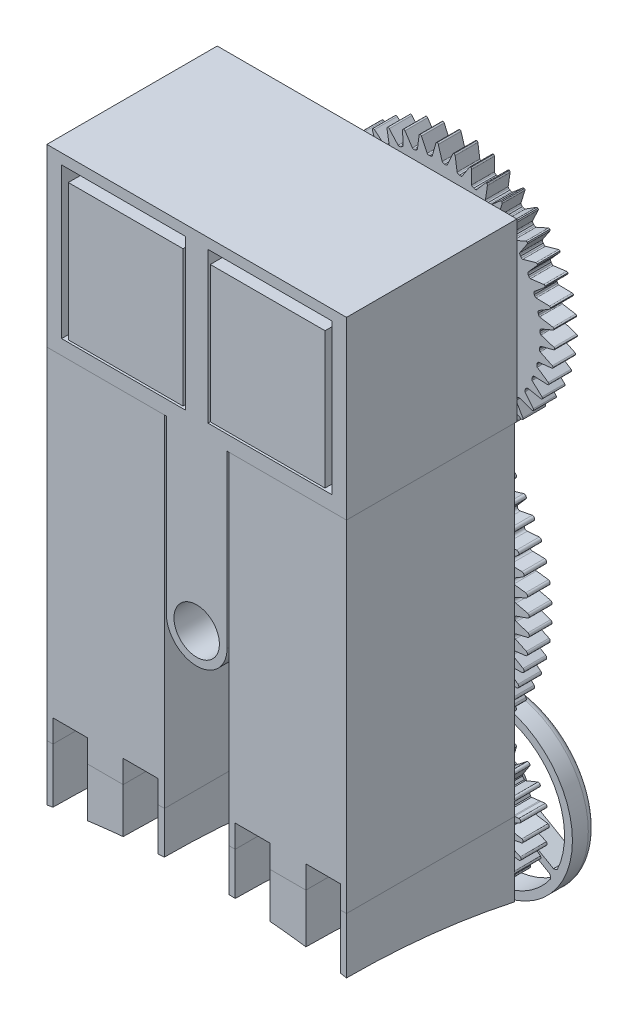
from build123d import *

# Parameters (mm, degrees)
SKETCH_1_R          = 2
SKETCH_1_W          = 10.907654696
SKETCH_1_H          = 13.247335826
EXTRUDE_1_DEPTH     = 15
SKETCH_5_W          = 10.1
SKETCH_5_H          = 12
EXTRUDE_2_DEPTH     = 15
EXTRUDE_2_2_DEPTH   = 15
SKETCH_6_R          = 2
EXTRUDE_6_DEPTH     = 2
SKETCH_7_R          = 0.632337003
EXTRUDE_8_DEPTH     = 2
EXTRUDE_12_DEPTH    = 30
EXTRUDE_12_2_DEPTH  = 30
SKETCH_12_W         = 9.258282927
SKETCH_12_H         = 14.590984707
SKETCH_12_W_2       = 3.147205335
SKETCH_12_H_2       = 10.970280427
CUT_EXTRUDE_2_DEPTH = 2
SKETCH_13_W         = 3.147205335
SKETCH_13_H         = 10.970280427
EXTRUDE_13_DEPTH    = 15
EXTRUDE_13_2_DEPTH  = 15
EXTRUDE_13_3_DEPTH  = 15
EXTRUDE_13_4_DEPTH  = 15
SKETCH_15_R         = 0.747038628
EXTRUDE_14_DEPTH    = 2.3
EXTRUDE_14_2_DEPTH  = 2.3
SKETCH_16_R         = 7.476126514
EXTRUDE_15_DEPTH    = 2
FILLET_1_R          = 0.6
FILLET_2_R          = 0.6


with BuildPart() as part:
    # 草图1 → 凸台-拉伸1 (new body)
    with BuildSketch(Plane.XY):
        with BuildLine():
            Line((13.190347486, 14.161568201), (13.190347486, -1.293872792))
            Line((13.190347486, -1.293872792), (2.674255419, -1.293872792))
            Line((2.674255419, -1.293872792), (2.674255419, -16.345919829))
            ThreePointArc((2.674255419, -16.345919829), (0, -19.020175248), (-2.674255419, -16.345919829))
            Line((-2.674255419, -16.345919829), (-2.674255419, -1.293872792))
            Line((-2.674255419, -1.293872792), (-13.190347486, -1.293872792))
            Line((-13.190347486, -1.293872792), (-13.190347486, 14.161568201))
            Line((-13.190347486, 14.161568201), (13.190347486, 14.161568201))
        make_face()
        with Locations((0, -16.345919829)):
            Circle(SKETCH_1_R, mode=Mode.SUBTRACT)
        with Locations((-6.440530121, 6.623667913)):
            Rectangle(SKETCH_1_W, SKETCH_1_H, mode=Mode.SUBTRACT)
        with Locations((6.440530121, 6.623667913)):
            Rectangle(SKETCH_1_W, SKETCH_1_H, mode=Mode.SUBTRACT)
    extrude(amount=EXTRUDE_1_DEPTH)


with BuildPart() as body_2:
    # 草图5 → 凸台-拉伸2 (new body)
    with BuildSketch(Plane.XY):
        with Locations((-6.25, 6.2)):
            Rectangle(SKETCH_5_W, SKETCH_5_H)
    extrude(amount=EXTRUDE_2_DEPTH)


with BuildPart() as body_3:
    # 草图5 → Extrude 2 2 (new body)
    with BuildSketch(Plane.XY):
        with Locations((6.25, 6.2)):
            Rectangle(SKETCH_5_W, SKETCH_5_H)
    extrude(amount=EXTRUDE_2_2_DEPTH)


with BuildPart() as body_4:
    # 草图6 → 凸台-拉伸6 (new body)
    with BuildSketch(Plane(origin=(0, 0, 0), x_dir=(-1, 0, 0), z_dir=(0, 0, -1))):
        with BuildLine():
            Line((0.557442462, -2.188166105), (0.208308475, -3.18943574))
            ThreePointArc((0.208308475, -3.18943574), (0.130268656, -3.302440773), (0, -3.345919829))
            ThreePointArc((0, -3.345919829), (-0.130268656, -3.302440773), (-0.208308475, -3.18943574))
            Line((-0.208308475, -3.18943574), (-0.557442462, -2.188166105))
            ThreePointArc((-0.557442462, -2.188166105), (-0.748436646, -2.064897881), (-0.925499507, -2.207455158))
            Line((-0.925499507, -2.207455158), (-1.168059724, -3.239734171))
            ThreePointArc((-1.168059724, -3.239734171), (-1.233859791, -3.360277534), (-1.358870022, -3.417135189))
            ThreePointArc((-1.358870022, -3.417135189), (-1.492969852, -3.387511099), (-1.582394404, -3.283282501))
            Line((-1.582394404, -3.283282501), (-2.034276974, -2.323992365))
            ThreePointArc((-2.034276974, -2.323992365), (-2.23710991, -2.221363746), (-2.398301508, -2.381648188))
            Line((-2.398301508, -2.381648188), (-2.531630417, -3.433626715))
            ThreePointArc((-2.531630417, -3.433626715), (-2.584469811, -3.560387709), (-2.702851981, -3.630001019))
            ThreePointArc((-2.702851981, -3.630001019), (-2.839313758, -3.614556462), (-2.939143288, -3.52024625))
            Line((-2.939143288, -3.52024625), (-3.488823521, -2.613445797))
            ThreePointArc((-3.488823521, -2.613445797), (-3.701272929, -2.532581203), (-3.844827217, -2.7088367))
            Line((-3.844827217, -2.7088367), (-3.867464037, -3.768989045))
            ThreePointArc((-3.867464037, -3.768989045), (-3.90676384, -3.900578849), (-4.017220927, -3.982185117))
            ThreePointArc((-4.017220927, -3.982185117), (-4.154549548, -3.981089306), (-4.263690303, -3.897730763))
            Line((-4.263690303, -3.897730763), (-4.905145788, -3.053355088))
            ThreePointArc((-4.905145788, -3.053355088), (-5.124884028, -2.995140489), (-5.249228194, -3.185435949))
            Line((-5.249228194, -3.185435949), (-5.160924912, -4.242146861))
            ThreePointArc((-5.160924912, -4.242146861), (-5.186254546, -4.37712375), (-5.28757636, -4.469828879))
            ThreePointArc((-5.28757636, -4.469828879), (-5.424267224, -4.483093822), (-5.541523435, -4.41160024))
            Line((-5.541523435, -4.41160024), (-6.267726252, -3.6389005))
            ThreePointArc((-6.267726252, -3.6389005), (-6.492345825, -3.603973707), (-6.596117529, -3.806224213))
            Line((-6.596117529, -3.806224213), (-6.397841613, -4.847916145))
            ThreePointArc((-6.397841613, -4.847916145), (-6.408923562, -4.984801285), (-6.5, -5.087589579))
            ThreePointArc((-6.5, -5.087589579), (-6.634555493, -5.115069941), (-6.758642476, -5.056224621))
            Line((-6.758642476, -5.056224621), (-7.561636195, -4.363666674))
            ThreePointArc((-7.561636195, -4.363666674), (-7.788676122, -4.352410353), (-7.870738419, -4.564400006))
            Line((-7.870738419, -4.564400006), (-7.564662223, -5.579659965))
            ThreePointArc((-7.564662223, -5.579659965), (-7.561375071, -5.716953612), (-7.64120828, -5.828698902))
            ThreePointArc((-7.64120828, -5.828698902), (-7.772154184, -5.870093602), (-7.901712416, -5.824541264))
            Line((-7.901712416, -5.824541264), (-8.772699269, -5.219712922))
            ThreePointArc((-8.772699269, -5.219712922), (-8.999672054, -5.232250399), (-9.059125853, -5.451656596))
            Line((-9.059125853, -5.451656596), (-8.648602811, -6.42936118))
            ThreePointArc((-8.648602811, -6.42936118), (-8.630982572, -6.565559118), (-8.698697883, -6.685037097))
            ThreePointArc((-8.698697883, -6.685037097), (-8.824599527, -6.739892607), (-8.958209542, -6.708132333))
            Line((-8.958209542, -6.708132333), (-9.887646815, -6.197660221))
            ThreePointArc((-9.887646815, -6.197660221), (-10.112065696, -6.233854133), (-10.148259608, -6.458273014))
            Line((-10.148259608, -6.458273014), (-9.637787496, -7.387710287))
            ThreePointArc((-9.637787496, -7.387710287), (-9.606027221, -7.521320302), (-9.660882731, -7.647221946))
            ThreePointArc((-9.660882731, -7.647221946), (-9.780360711, -7.714937257), (-9.916558649, -7.697317018))
            Line((-9.916558649, -7.697317018), (-10.894263232, -7.286793976))
            ThreePointArc((-10.894263232, -7.286793976), (-11.11366943, -7.346247774), (-11.126206907, -7.57322056))
            Line((-11.126206907, -7.57322056), (-10.521378565, -8.444207412))
            ThreePointArc((-10.521378565, -8.444207412), (-10.475826227, -8.573765645), (-10.517220927, -8.704711549))
            ThreePointArc((-10.517220927, -8.704711549), (-10.628966217, -8.784544758), (-10.766259864, -8.781257606))
            Line((-10.766259864, -8.781257606), (-11.781519822, -8.475181409))
            ThreePointArc((-11.781519822, -8.475181409), (-11.993509475, -8.557243706), (-11.982253154, -8.784283634))
            Line((-11.982253154, -8.784283634), (-11.289695208, -9.587277353))
            ThreePointArc((-11.289695208, -9.587277353), (-11.230849888, -9.711364335), (-11.258330249, -9.845919829))
            ThreePointArc((-11.258330249, -9.845919829), (-11.361118544, -9.936996266), (-11.498003683, -9.948078216))
            Line((-11.498003683, -9.948078216), (-12.539695616, -9.7498023))
            ThreePointArc((-12.539695616, -9.7498023), (-12.741946122, -9.853574004), (-12.707019329, -10.078193577))
            Line((-12.707019329, -10.078193577), (-11.934319588, -10.804396394))
            ThreePointArc((-11.934319588, -10.804396394), (-11.862826007, -10.921652605), (-11.876090949, -11.058343469))
            ThreePointArc((-11.876090949, -11.058343469), (-11.968796079, -11.159665283), (-12.103772968, -11.184994917))
            Line((-12.103772968, -11.184994917), (-13.16048388, -11.096691634))
            ThreePointArc((-13.16048388, -11.096691634), (-13.35077934, -11.221035801), (-13.292564741, -11.44077404))
            Line((-13.292564741, -11.44077404), (-12.448189066, -12.082229526))
            ThreePointArc((-12.448189066, -12.082229526), (-12.364830522, -12.19137028), (-12.363734712, -12.328698902))
            ThreePointArc((-12.363734712, -12.328698902), (-12.445340979, -12.439155989), (-12.576930783, -12.478455792))
            Line((-12.576930783, -12.478455792), (-13.637083129, -12.501092611))
            ThreePointArc((-13.637083129, -12.501092611), (-13.813338625, -12.644646899), (-13.732474032, -12.857096307))
            Line((-13.732474032, -12.857096307), (-12.825673579, -13.406776541))
            ThreePointArc((-12.825673579, -13.406776541), (-12.731363367, -13.506606071), (-12.71591881, -13.643067848))
            ThreePointArc((-12.71591881, -13.643067848), (-12.78553212, -13.761450017), (-12.912293113, -13.814289412))
            Line((-12.912293113, -13.814289412), (-13.964271641, -13.94761832))
            ThreePointArc((-13.964271641, -13.94761832), (-14.124556082, -14.108809919), (-14.021927463, -14.311642855))
            Line((-14.021927463, -14.311642855), (-13.062637328, -14.763525425))
            ThreePointArc((-13.062637328, -14.763525425), (-12.95840873, -14.852949977), (-12.92878464, -14.987049806))
            ThreePointArc((-12.92878464, -14.987049806), (-12.985642295, -15.112060038), (-13.106185657, -15.177860105))
            Line((-13.106185657, -15.177860105), (-14.138464671, -15.420420322))
            ThreePointArc((-14.138464671, -15.420420322), (-14.281021947, -15.597483182), (-14.157753723, -15.788477367))
            Line((-14.157753723, -15.788477367), (-13.156484089, -16.137611353))
            ThreePointArc((-13.156484089, -16.137611353), (-13.043479055, -16.215651173), (-13, -16.345919829))
            ThreePointArc((-13, -16.345919829), (-13.043479055, -16.476188485), (-13.156484089, -16.554228304))
            Line((-13.156484089, -16.554228304), (-14.157753723, -16.90336229))
            ThreePointArc((-14.157753723, -16.90336229), (-14.281021947, -17.094356475), (-14.138464671, -17.271419335))
            Line((-14.138464671, -17.271419335), (-13.106185657, -17.513979553))
            ThreePointArc((-13.106185657, -17.513979553), (-12.985642295, -17.579779619), (-12.92878464, -17.704789851))
            ThreePointArc((-12.92878464, -17.704789851), (-12.95840873, -17.838889681), (-13.062637328, -17.928314232))
            Line((-13.062637328, -17.928314232), (-14.021927463, -18.380196802))
            ThreePointArc((-14.021927463, -18.380196802), (-14.124556082, -18.583029739), (-13.964271641, -18.744221337))
            Line((-13.964271641, -18.744221337), (-12.912293113, -18.877550245))
            ThreePointArc((-12.912293113, -18.877550245), (-12.78553212, -18.93038964), (-12.71591881, -19.048771809))
            ThreePointArc((-12.71591881, -19.048771809), (-12.731363367, -19.185233587), (-12.825673579, -19.285063116))
            Line((-12.825673579, -19.285063116), (-13.732474032, -19.83474335))
            ThreePointArc((-13.732474032, -19.83474335), (-13.813338625, -20.047192758), (-13.637083129, -20.190747046))
            Line((-13.637083129, -20.190747046), (-12.576930783, -20.213383866))
            ThreePointArc((-12.576930783, -20.213383866), (-12.445340979, -20.252683668), (-12.363734712, -20.363140756))
            ThreePointArc((-12.363734712, -20.363140756), (-12.364830522, -20.500469377), (-12.448189066, -20.609610131))
            Line((-12.448189066, -20.609610131), (-13.292564741, -21.251065617))
            ThreePointArc((-13.292564741, -21.251065617), (-13.35077934, -21.470803857), (-13.16048388, -21.595148023))
            Line((-13.16048388, -21.595148023), (-12.103772968, -21.50684474))
            ThreePointArc((-12.103772968, -21.50684474), (-11.968796079, -21.532174375), (-11.876090949, -21.633496189))
            ThreePointArc((-11.876090949, -21.633496189), (-11.862826007, -21.770187053), (-11.934319588, -21.887443263))
            Line((-11.934319588, -21.887443263), (-12.707019329, -22.61364608))
            ThreePointArc((-12.707019329, -22.61364608), (-12.741946122, -22.838265654), (-12.539695616, -22.942037357))
            Line((-12.539695616, -22.942037357), (-11.498003683, -22.743761442))
            ThreePointArc((-11.498003683, -22.743761442), (-11.361118544, -22.754843391), (-11.258330249, -22.845919829))
            ThreePointArc((-11.258330249, -22.845919829), (-11.230849888, -22.980475322), (-11.289695208, -23.104562305))
            Line((-11.289695208, -23.104562305), (-11.982253154, -23.907556023))
            ThreePointArc((-11.982253154, -23.907556023), (-11.993509475, -24.134595951), (-11.781519822, -24.216658248))
            Line((-11.781519822, -24.216658248), (-10.766259864, -23.910582052))
            ThreePointArc((-10.766259864, -23.910582052), (-10.628966217, -23.907294899), (-10.517220927, -23.987128108))
            ThreePointArc((-10.517220927, -23.987128108), (-10.475826227, -24.118074013), (-10.521378565, -24.247632245))
            Line((-10.521378565, -24.247632245), (-11.126206907, -25.118619098))
            ThreePointArc((-11.126206907, -25.118619098), (-11.11366943, -25.345591883), (-10.894263232, -25.405045681))
            Line((-10.894263232, -25.405045681), (-9.916558649, -24.994522639))
            ThreePointArc((-9.916558649, -24.994522639), (-9.780360711, -24.9769024), (-9.660882731, -25.044617711))
            ThreePointArc((-9.660882731, -25.044617711), (-9.606027221, -25.170519356), (-9.637787496, -25.30412937))
            Line((-9.637787496, -25.30412937), (-10.148259608, -26.233566643))
            ThreePointArc((-10.148259608, -26.233566643), (-10.112065696, -26.457985525), (-9.887646815, -26.494179436))
            Line((-9.887646815, -26.494179436), (-8.958209542, -25.983707325))
            ThreePointArc((-8.958209542, -25.983707325), (-8.824599527, -25.95194705), (-8.698697883, -26.00680256))
            ThreePointArc((-8.698697883, -26.00680256), (-8.630982572, -26.12628054), (-8.648602811, -26.262478477))
            Line((-8.648602811, -26.262478477), (-9.059125853, -27.240183061))
            ThreePointArc((-9.059125853, -27.240183061), (-8.999672054, -27.459589258), (-8.772699269, -27.472126735))
            Line((-8.772699269, -27.472126735), (-7.901712416, -26.867298393))
            ThreePointArc((-7.901712416, -26.867298393), (-7.772154184, -26.821746055), (-7.64120828, -26.863140756))
            ThreePointArc((-7.64120828, -26.863140756), (-7.561375071, -26.974886045), (-7.564662223, -27.112179693))
            Line((-7.564662223, -27.112179693), (-7.870738419, -28.127439651))
            ThreePointArc((-7.870738419, -28.127439651), (-7.788676122, -28.339429304), (-7.561636195, -28.328172983))
            Line((-7.561636195, -28.328172983), (-6.758642476, -27.635615037))
            ThreePointArc((-6.758642476, -27.635615037), (-6.634555493, -27.576769716), (-6.5, -27.604250078))
            ThreePointArc((-6.5, -27.604250078), (-6.408923562, -27.707038372), (-6.397841613, -27.843923512))
            Line((-6.397841613, -27.843923512), (-6.596117529, -28.885615445))
            ThreePointArc((-6.596117529, -28.885615445), (-6.492345825, -29.08786595), (-6.267726252, -29.052939158))
            Line((-6.267726252, -29.052939158), (-5.541523435, -28.280239417))
            ThreePointArc((-5.541523435, -28.280239417), (-5.424267224, -28.208745836), (-5.28757636, -28.222010778))
            ThreePointArc((-5.28757636, -28.222010778), (-5.186254546, -28.314715907), (-5.160924912, -28.449692797))
            Line((-5.160924912, -28.449692797), (-5.249228194, -29.506403709))
            ThreePointArc((-5.249228194, -29.506403709), (-5.124884028, -29.696699168), (-4.905145788, -29.638484569))
            Line((-4.905145788, -29.638484569), (-4.263690303, -28.794108894))
            ThreePointArc((-4.263690303, -28.794108894), (-4.154549548, -28.710750351), (-4.017220927, -28.70965454))
            ThreePointArc((-4.017220927, -28.70965454), (-3.90676384, -28.791260808), (-3.867464037, -28.922850612))
            Line((-3.867464037, -28.922850612), (-3.844827217, -29.983002957))
            ThreePointArc((-3.844827217, -29.983002957), (-3.701272929, -30.159258454), (-3.488823521, -30.07839386))
            Line((-3.488823521, -30.07839386), (-2.939143288, -29.171593407))
            ThreePointArc((-2.939143288, -29.171593407), (-2.839313758, -29.077283195), (-2.702851981, -29.061838638))
            ThreePointArc((-2.702851981, -29.061838638), (-2.584469811, -29.131451948), (-2.531630417, -29.258212942))
            Line((-2.531630417, -29.258212942), (-2.398301508, -30.31019147))
            ThreePointArc((-2.398301508, -30.31019147), (-2.23710991, -30.470475911), (-2.034276974, -30.367847292))
            Line((-2.034276974, -30.367847292), (-1.582394404, -29.408557157))
            ThreePointArc((-1.582394404, -29.408557157), (-1.492969852, -29.304328559), (-1.358870022, -29.274704468))
            ThreePointArc((-1.358870022, -29.274704468), (-1.233859791, -29.331562123), (-1.168059724, -29.452105486))
            Line((-1.168059724, -29.452105486), (-0.925499507, -30.4843845))
            ThreePointArc((-0.925499507, -30.4843845), (-0.748436646, -30.626941776), (-0.557442462, -30.503673552))
            Line((-0.557442462, -30.503673552), (-0.208308475, -29.502403918))
            ThreePointArc((-0.208308475, -29.502403918), (-0.130268656, -29.389398884), (0, -29.345919829))
            ThreePointArc((0, -29.345919829), (0.130268656, -29.389398884), (0.208308475, -29.502403918))
            Line((0.208308475, -29.502403918), (0.557442462, -30.503673552))
            ThreePointArc((0.557442462, -30.503673552), (0.748436646, -30.626941776), (0.925499507, -30.4843845))
            Line((0.925499507, -30.4843845), (1.168059724, -29.452105486))
            ThreePointArc((1.168059724, -29.452105486), (1.233859791, -29.331562123), (1.358870022, -29.274704468))
            ThreePointArc((1.358870022, -29.274704468), (1.492969852, -29.304328559), (1.582394404, -29.408557157))
            Line((1.582394404, -29.408557157), (2.034276974, -30.367847292))
            ThreePointArc((2.034276974, -30.367847292), (2.23710991, -30.470475911), (2.398301508, -30.31019147))
            Line((2.398301508, -30.31019147), (2.531630417, -29.258212942))
            ThreePointArc((2.531630417, -29.258212942), (2.584469811, -29.131451948), (2.702851981, -29.061838638))
            ThreePointArc((2.702851981, -29.061838638), (2.839313758, -29.077283195), (2.939143288, -29.171593407))
            Line((2.939143288, -29.171593407), (3.488823521, -30.07839386))
            ThreePointArc((3.488823521, -30.07839386), (3.701272929, -30.159258454), (3.844827217, -29.983002957))
            Line((3.844827217, -29.983002957), (3.867464037, -28.922850612))
            ThreePointArc((3.867464037, -28.922850612), (3.90676384, -28.791260808), (4.017220927, -28.70965454))
            ThreePointArc((4.017220927, -28.70965454), (4.154549548, -28.710750351), (4.263690303, -28.794108894))
            Line((4.263690303, -28.794108894), (4.905145788, -29.638484569))
            ThreePointArc((4.905145788, -29.638484569), (5.124884028, -29.696699168), (5.249228194, -29.506403709))
            Line((5.249228194, -29.506403709), (5.160924912, -28.449692797))
            ThreePointArc((5.160924912, -28.449692797), (5.186254546, -28.314715907), (5.28757636, -28.222010778))
            ThreePointArc((5.28757636, -28.222010778), (5.424267224, -28.208745836), (5.541523435, -28.280239417))
            Line((5.541523435, -28.280239417), (6.267726252, -29.052939158))
            ThreePointArc((6.267726252, -29.052939158), (6.492345825, -29.08786595), (6.596117529, -28.885615445))
            Line((6.596117529, -28.885615445), (6.397841613, -27.843923512))
            ThreePointArc((6.397841613, -27.843923512), (6.408923562, -27.707038372), (6.5, -27.604250078))
            ThreePointArc((6.5, -27.604250078), (6.634555493, -27.576769716), (6.758642476, -27.635615037))
            Line((6.758642476, -27.635615037), (7.561636195, -28.328172983))
            ThreePointArc((7.561636195, -28.328172983), (7.788676122, -28.339429304), (7.870738419, -28.127439651))
            Line((7.870738419, -28.127439651), (7.564662223, -27.112179693))
            ThreePointArc((7.564662223, -27.112179693), (7.561375071, -26.974886045), (7.64120828, -26.863140756))
            ThreePointArc((7.64120828, -26.863140756), (7.772154184, -26.821746055), (7.901712416, -26.867298393))
            Line((7.901712416, -26.867298393), (8.772699269, -27.472126735))
            ThreePointArc((8.772699269, -27.472126735), (8.999672054, -27.459589258), (9.059125853, -27.240183061))
            Line((9.059125853, -27.240183061), (8.648602811, -26.262478477))
            ThreePointArc((8.648602811, -26.262478477), (8.630982572, -26.12628054), (8.698697883, -26.00680256))
            ThreePointArc((8.698697883, -26.00680256), (8.824599527, -25.95194705), (8.958209542, -25.983707325))
            Line((8.958209542, -25.983707325), (9.887646815, -26.494179436))
            ThreePointArc((9.887646815, -26.494179436), (10.112065696, -26.457985525), (10.148259608, -26.233566643))
            Line((10.148259608, -26.233566643), (9.637787496, -25.30412937))
            ThreePointArc((9.637787496, -25.30412937), (9.606027221, -25.170519356), (9.660882731, -25.044617711))
            ThreePointArc((9.660882731, -25.044617711), (9.780360711, -24.9769024), (9.916558649, -24.994522639))
            Line((9.916558649, -24.994522639), (10.894263232, -25.405045681))
            ThreePointArc((10.894263232, -25.405045681), (11.11366943, -25.345591883), (11.126206907, -25.118619098))
            Line((11.126206907, -25.118619098), (10.521378565, -24.247632245))
            ThreePointArc((10.521378565, -24.247632245), (10.475826227, -24.118074013), (10.517220927, -23.987128108))
            ThreePointArc((10.517220927, -23.987128108), (10.628966217, -23.907294899), (10.766259864, -23.910582052))
            Line((10.766259864, -23.910582052), (11.781519822, -24.216658248))
            ThreePointArc((11.781519822, -24.216658248), (11.993509475, -24.134595951), (11.982253154, -23.907556023))
            Line((11.982253154, -23.907556023), (11.289695208, -23.104562305))
            ThreePointArc((11.289695208, -23.104562305), (11.230849888, -22.980475322), (11.258330249, -22.845919829))
            ThreePointArc((11.258330249, -22.845919829), (11.361118544, -22.754843391), (11.498003683, -22.743761442))
            Line((11.498003683, -22.743761442), (12.539695616, -22.942037357))
            ThreePointArc((12.539695616, -22.942037357), (12.741946122, -22.838265654), (12.707019329, -22.61364608))
            Line((12.707019329, -22.61364608), (11.934319588, -21.887443263))
            ThreePointArc((11.934319588, -21.887443263), (11.862826007, -21.770187053), (11.876090949, -21.633496189))
            ThreePointArc((11.876090949, -21.633496189), (11.968796079, -21.532174375), (12.103772968, -21.50684474))
            Line((12.103772968, -21.50684474), (13.16048388, -21.595148023))
            ThreePointArc((13.16048388, -21.595148023), (13.35077934, -21.470803857), (13.292564741, -21.251065617))
            Line((13.292564741, -21.251065617), (12.448189066, -20.609610131))
            ThreePointArc((12.448189066, -20.609610131), (12.364830522, -20.500469377), (12.363734712, -20.363140756))
            ThreePointArc((12.363734712, -20.363140756), (12.445340979, -20.252683668), (12.576930783, -20.213383866))
            Line((12.576930783, -20.213383866), (13.637083129, -20.190747046))
            ThreePointArc((13.637083129, -20.190747046), (13.813338625, -20.047192758), (13.732474032, -19.83474335))
            Line((13.732474032, -19.83474335), (12.825673579, -19.285063116))
            ThreePointArc((12.825673579, -19.285063116), (12.731363367, -19.185233587), (12.71591881, -19.048771809))
            ThreePointArc((12.71591881, -19.048771809), (12.78553212, -18.93038964), (12.912293113, -18.877550245))
            Line((12.912293113, -18.877550245), (13.964271641, -18.744221337))
            ThreePointArc((13.964271641, -18.744221337), (14.124556082, -18.583029739), (14.021927463, -18.380196802))
            Line((14.021927463, -18.380196802), (13.062637328, -17.928314232))
            ThreePointArc((13.062637328, -17.928314232), (12.95840873, -17.838889681), (12.92878464, -17.704789851))
            ThreePointArc((12.92878464, -17.704789851), (12.985642295, -17.579779619), (13.106185657, -17.513979553))
            Line((13.106185657, -17.513979553), (14.138464671, -17.271419335))
            ThreePointArc((14.138464671, -17.271419335), (14.281021947, -17.094356475), (14.157753723, -16.90336229))
            Line((14.157753723, -16.90336229), (13.156484089, -16.554228304))
            ThreePointArc((13.156484089, -16.554228304), (13.043479055, -16.476188485), (13, -16.345919829))
            ThreePointArc((13, -16.345919829), (13.043479055, -16.215651173), (13.156484089, -16.137611353))
            Line((13.156484089, -16.137611353), (14.157753723, -15.788477367))
            ThreePointArc((14.157753723, -15.788477367), (14.281021947, -15.597483182), (14.138464671, -15.420420322))
            Line((14.138464671, -15.420420322), (13.106185657, -15.177860105))
            ThreePointArc((13.106185657, -15.177860105), (12.985642295, -15.112060038), (12.92878464, -14.987049806))
            ThreePointArc((12.92878464, -14.987049806), (12.95840873, -14.852949977), (13.062637328, -14.763525425))
            Line((13.062637328, -14.763525425), (14.021927463, -14.311642855))
            ThreePointArc((14.021927463, -14.311642855), (14.124556082, -14.108809919), (13.964271641, -13.94761832))
            Line((13.964271641, -13.94761832), (12.912293113, -13.814289412))
            ThreePointArc((12.912293113, -13.814289412), (12.78553212, -13.761450017), (12.71591881, -13.643067848))
            ThreePointArc((12.71591881, -13.643067848), (12.731363367, -13.506606071), (12.825673579, -13.406776541))
            Line((12.825673579, -13.406776541), (13.732474032, -12.857096307))
            ThreePointArc((13.732474032, -12.857096307), (13.813338625, -12.644646899), (13.637083129, -12.501092611))
            Line((13.637083129, -12.501092611), (12.576930783, -12.478455792))
            ThreePointArc((12.576930783, -12.478455792), (12.445340979, -12.439155989), (12.363734712, -12.328698902))
            ThreePointArc((12.363734712, -12.328698902), (12.364830522, -12.19137028), (12.448189066, -12.082229526))
            Line((12.448189066, -12.082229526), (13.292564741, -11.44077404))
            ThreePointArc((13.292564741, -11.44077404), (13.35077934, -11.221035801), (13.16048388, -11.096691634))
            Line((13.16048388, -11.096691634), (12.103772968, -11.184994917))
            ThreePointArc((12.103772968, -11.184994917), (11.968796079, -11.159665283), (11.876090949, -11.058343469))
            ThreePointArc((11.876090949, -11.058343469), (11.862826007, -10.921652605), (11.934319588, -10.804396394))
            Line((11.934319588, -10.804396394), (12.707019329, -10.078193577))
            ThreePointArc((12.707019329, -10.078193577), (12.741946122, -9.853574004), (12.539695616, -9.7498023))
            Line((12.539695616, -9.7498023), (11.498003683, -9.948078216))
            ThreePointArc((11.498003683, -9.948078216), (11.361118544, -9.936996266), (11.258330249, -9.845919829))
            ThreePointArc((11.258330249, -9.845919829), (11.230849888, -9.711364335), (11.289695208, -9.587277353))
            Line((11.289695208, -9.587277353), (11.982253154, -8.784283634))
            ThreePointArc((11.982253154, -8.784283634), (11.993509475, -8.557243706), (11.781519822, -8.475181409))
            Line((11.781519822, -8.475181409), (10.766259864, -8.781257606))
            ThreePointArc((10.766259864, -8.781257606), (10.628966217, -8.784544758), (10.517220927, -8.704711549))
            ThreePointArc((10.517220927, -8.704711549), (10.475826227, -8.573765645), (10.521378565, -8.444207412))
            Line((10.521378565, -8.444207412), (11.126206907, -7.57322056))
            ThreePointArc((11.126206907, -7.57322056), (11.11366943, -7.346247774), (10.894263232, -7.286793976))
            Line((10.894263232, -7.286793976), (9.916558649, -7.697317018))
            ThreePointArc((9.916558649, -7.697317018), (9.780360711, -7.714937257), (9.660882731, -7.647221946))
            ThreePointArc((9.660882731, -7.647221946), (9.606027221, -7.521320302), (9.637787496, -7.387710287))
            Line((9.637787496, -7.387710287), (10.148259608, -6.458273014))
            ThreePointArc((10.148259608, -6.458273014), (10.112065696, -6.233854133), (9.887646815, -6.197660221))
            Line((9.887646815, -6.197660221), (8.958209542, -6.708132333))
            ThreePointArc((8.958209542, -6.708132333), (8.824599527, -6.739892607), (8.698697883, -6.685037097))
            ThreePointArc((8.698697883, -6.685037097), (8.630982572, -6.565559118), (8.648602811, -6.42936118))
            Line((8.648602811, -6.42936118), (9.059125853, -5.451656596))
            ThreePointArc((9.059125853, -5.451656596), (8.999672054, -5.232250399), (8.772699269, -5.219712922))
            Line((8.772699269, -5.219712922), (7.901712416, -5.824541264))
            ThreePointArc((7.901712416, -5.824541264), (7.772154184, -5.870093602), (7.64120828, -5.828698902))
            ThreePointArc((7.64120828, -5.828698902), (7.561375071, -5.716953612), (7.564662223, -5.579659965))
            Line((7.564662223, -5.579659965), (7.870738419, -4.564400006))
            ThreePointArc((7.870738419, -4.564400006), (7.788676122, -4.352410353), (7.561636195, -4.363666674))
            Line((7.561636195, -4.363666674), (6.758642476, -5.056224621))
            ThreePointArc((6.758642476, -5.056224621), (6.634555493, -5.115069941), (6.5, -5.087589579))
            ThreePointArc((6.5, -5.087589579), (6.408923562, -4.984801285), (6.397841613, -4.847916145))
            Line((6.397841613, -4.847916145), (6.596117529, -3.806224213))
            ThreePointArc((6.596117529, -3.806224213), (6.492345825, -3.603973707), (6.267726252, -3.6389005))
            Line((6.267726252, -3.6389005), (5.541523435, -4.41160024))
            ThreePointArc((5.541523435, -4.41160024), (5.424267224, -4.483093822), (5.28757636, -4.469828879))
            ThreePointArc((5.28757636, -4.469828879), (5.186254546, -4.37712375), (5.160924912, -4.242146861))
            Line((5.160924912, -4.242146861), (5.249228194, -3.185435949))
            ThreePointArc((5.249228194, -3.185435949), (5.124884028, -2.995140489), (4.905145788, -3.053355088))
            Line((4.905145788, -3.053355088), (4.263690303, -3.897730763))
            ThreePointArc((4.263690303, -3.897730763), (4.154549548, -3.981089306), (4.017220927, -3.982185117))
            ThreePointArc((4.017220927, -3.982185117), (3.90676384, -3.900578849), (3.867464037, -3.768989045))
            Line((3.867464037, -3.768989045), (3.844827217, -2.7088367))
            ThreePointArc((3.844827217, -2.7088367), (3.701272929, -2.532581203), (3.488823521, -2.613445797))
            Line((3.488823521, -2.613445797), (2.939143288, -3.52024625))
            ThreePointArc((2.939143288, -3.52024625), (2.839313758, -3.614556462), (2.702851981, -3.630001019))
            ThreePointArc((2.702851981, -3.630001019), (2.584469811, -3.560387709), (2.531630417, -3.433626715))
            Line((2.531630417, -3.433626715), (2.398301508, -2.381648188))
            ThreePointArc((2.398301508, -2.381648188), (2.23710991, -2.221363746), (2.034276974, -2.323992365))
            Line((2.034276974, -2.323992365), (1.582394404, -3.283282501))
            ThreePointArc((1.582394404, -3.283282501), (1.492969852, -3.387511099), (1.358870022, -3.417135189))
            ThreePointArc((1.358870022, -3.417135189), (1.233859791, -3.360277534), (1.168059724, -3.239734171))
            Line((1.168059724, -3.239734171), (0.925499507, -2.207455158))
            ThreePointArc((0.925499507, -2.207455158), (0.748436646, -2.064897881), (0.557442462, -2.188166105))
        make_face()
        with Locations((0, -16.345919829)):
            Circle(SKETCH_6_R, mode=Mode.SUBTRACT)
    extrude(amount=EXTRUDE_6_DEPTH)


with BuildPart() as body_5:
    # 草图7 → 凸台-拉伸8 (new body)
    with BuildSketch(Plane(origin=(0, 0, 0), x_dir=(-1, 0, 0), z_dir=(0, 0, -1))):
        with BuildLine():
            ThreePointArc((-4.887800391, -2.693136084), (-4.825644916, -2.70729745), (-4.775758529, -2.746986187))
            Line((-4.775758529, -2.746986187), (-4.218362124, -3.784403001))
            ThreePointArc((-4.218362124, -3.784403001), (-4.166914491, -3.835649268), (-4.09581457, -3.850408672))
            ThreePointArc((-4.09581457, -3.850408672), (-4.037009591, -3.8078057), (-4.011084575, -3.739975526))
            Line((-4.011084575, -3.739975526), (-3.927835816, -2.56524405))
            ThreePointArc((-3.927835816, -2.56524405), (-3.898598073, -2.508595998), (-3.847706703, -2.470204386))
            Line((-3.847706703, -2.470204386), (-3.73246244, -2.418423038))
            Line((-3.73246244, -2.418423038), (-3.607465852, -2.400027352))
            ThreePointArc((-3.607465852, -2.400027352), (-3.543910833, -2.404987896), (-3.488777341, -2.436990169))
            Line((-3.488777341, -2.436990169), (-2.786271805, -3.382194046))
            ThreePointArc((-2.786271805, -3.382194046), (-2.727910914, -3.425403365), (-2.655419692, -3.429653252))
            ThreePointArc((-2.655419692, -3.429653252), (-2.603444419, -3.37894221), (-2.587671829, -3.308060165))
            Line((-2.587671829, -3.308060165), (-2.676352496, -2.133726253))
            ThreePointArc((-2.676352496, -2.133726253), (-2.655674351, -2.073424829), (-2.610915175, -2.0280325))
            Line((-2.610915175, -2.0280325), (-2.504438453, -1.960023267))
            Line((-2.504438453, -1.960023267), (-2.383452341, -1.923623969))
            ThreePointArc((-2.383452341, -1.923623969), (-2.319852344, -1.919277965), (-2.26064682, -1.9429117))
            Line((-2.26064682, -1.9429117), (-1.428004839, -2.775757261))
            ThreePointArc((-1.428004839, -2.775757261), (-1.363974551, -2.810008701), (-1.291637053, -2.803658492))
            ThreePointArc((-1.291637053, -2.803658492), (-1.247599248, -2.745920198), (-1.242315249, -2.67349701))
            Line((-1.242315249, -2.67349701), (-1.501035268, -1.52458955))
            ThreePointArc((-1.501035268, -1.52458955), (-1.48935744, -1.461919974), (-1.451684422, -1.410494386))
            Line((-1.451684422, -1.410494386), (-1.356244607, -1.327706767))
            Line((-1.356244607, -1.327706767), (-1.24184758, -1.274079644))
            ThreePointArc((-1.24184758, -1.274079644), (-1.179558128, -1.26051972), (-1.117542437, -1.275281206))
            Line((-1.117542437, -1.275281206), (-0.172510328, -1.978017793))
            ThreePointArc((-0.172510328, -1.978017793), (-0.104175338, -2.002581343), (-0.033533311, -1.985766382))
            ThreePointArc((-0.033533311, -1.985766382), (0.001628436, -1.922231428), (-0.003688776, -1.849810671))
            Line((-0.003688776, -1.849810671), (-0.426933979, -0.750816632))
            ThreePointArc((-0.426933979, -0.750816632), (-0.424505361, -0.687114598), (-0.394721436, -0.630751798))
            Line((-0.394721436, -0.630751798), (-0.312352661, -0.534950267))
            Line((-0.312352661, -0.534950267), (-0.206982893, -0.465238288))
            ThreePointArc((-0.206982893, -0.465238288), (-0.147331577, -0.44275345), (-0.083827475, -0.448328071))
            Line((-0.083827475, -0.448328071), (0.953453042, -1.005978074))
            ThreePointArc((0.953453042, -1.005978074), (1.024636293, -1.020330206), (1.092077235, -0.993408873))
            ThreePointArc((1.092077235, -0.993408873), (1.117613513, -0.925431397), (1.101808418, -0.854556593))
            Line((1.101808418, -0.854556593), (0.523058769, 0.171100875))
            ThreePointArc((0.523058769, 0.171100875), (0.516186415, 0.23447767), (0.537446454, 0.294576406))
            Line((0.537446454, 0.294576406), (0.60498864, 0.401350005))
            Line((0.60498864, 0.401350005), (0.699085376, 0.485661051))
            ThreePointArc((0.699085376, 0.485661051), (0.754827191, 0.516591577), (0.818466225, 0.520322634))
            Line((0.818466225, 0.520322634), (1.925887317, 0.119644556))
            ThreePointArc((1.925887317, 0.119644556), (1.998401681, 0.115809735), (2.061204153, 0.152263656))
            ThreePointArc((2.061204153, 0.152263656), (2.0765707, 0.223234834), (2.05061458, 0.291053111))
            Line((2.05061458, 0.291053111), (1.328695527, 1.221513899))
            ThreePointArc((1.328695527, 1.221513899), (1.312668674, 1.283214689), (1.324951707, 1.345768462))
            Line((1.324951707, 1.345768462), (1.37622776, 1.461238434))
            Line((1.37622776, 1.461238434), (1.457045955, 1.558351603))
            ThreePointArc((1.457045955, 1.558351603), (1.507690229, 1.597068588), (1.570107839, 1.610025802))
            Line((1.570107839, 1.610025802), (2.724066748, 1.374859407))
            ThreePointArc((2.724066748, 1.374859407), (2.796366708, 1.381623628), (2.853192183, 1.426833186))
            ThreePointArc((2.853192183, 1.426833186), (2.858061488, 1.499285438), (2.822507553, 1.562601758))
            Line((2.822507553, 1.562601758), (1.972805548, 2.378034712))
            ThreePointArc((1.972805548, 2.378034712), (1.947965781, 2.43674445), (1.951010015, 2.500420034))
            Line((1.951010015, 2.500420034), (1.984927075, 2.622125339))
            Line((1.984927075, 2.622125339), (2.050744229, 2.729970833))
            ThreePointArc((2.050744229, 2.729970833), (2.095211568, 2.77564909), (2.155077431, 2.797556301))
            Line((2.155077431, 2.797556301), (3.330979527, 2.732913752))
            ThreePointArc((3.330979527, 2.732913752), (3.401524134, 2.750132848), (3.451161476, 2.80313448))
            ThreePointArc((3.451161476, 2.80313448), (3.445429759, 2.875523611), (3.401035778, 2.932988498))
            Line((3.401035778, 2.932988498), (2.441660745, 3.616014079))
            ThreePointArc((2.441660745, 3.616014079), (2.408537479, 3.67048147), (2.402278033, 3.733921731))
            Line((2.402278033, 3.733921731), (2.418113217, 3.859268431))
            Line((2.418113217, 3.859268431), (2.467526552, 3.975547709))
            ThreePointArc((2.467526552, 3.975547709), (2.504869211, 4.027213686), (2.56090739, 4.05760398))
            Line((2.56090739, 4.05760398), (3.733690361, 4.164863021))
            ThreePointArc((3.733690361, 4.164863021), (3.800976079, 4.192169996), (3.842367355, 4.251834065))
            ThreePointArc((3.842367355, 4.251834065), (3.826156777, 4.322617227), (3.773868932, 4.373005917))
            Line((3.773868932, 4.373005917), (2.725268283, 4.90906662))
            ThreePointArc((2.725268283, 4.90906662), (2.684567484, 4.958130786), (2.669137766, 5.019983605))
            Line((2.669137766, 5.019983605), (2.666553575, 5.146300152))
            Line((2.666553575, 5.146300152), (2.698509932, 5.268534924))
            ThreePointArc((2.698509932, 5.268534924), (2.727932017, 5.325087451), (2.778948155, 5.36331311))
            Line((2.778948155, 5.36331311), (3.923616168, 5.640187702))
            ThreePointArc((3.923616168, 5.640187702), (3.98620892, 5.677000556), (4.018471946, 5.742055424))
            ThreePointArc((4.018471946, 5.742055424), (3.992128007, 5.809723997), (3.933060722, 5.851962542))
            Line((3.933060722, 5.851962542), (2.81758356, 6.229633165))
            ThreePointArc((2.81758356, 6.229633165), (2.770172695, 6.272248388), (2.745901563, 6.331195479))
            Line((2.745901563, 6.331195479), (2.724953074, 6.455789656))
            Line((2.724953074, 6.455789656), (2.738771358, 6.5813747))
            ThreePointArc((2.738771358, 6.5813747), (2.759645789, 6.641608457), (2.804552566, 6.686854769))
            Line((2.804552566, 6.686854769), (3.896709009, 7.127443809))
            ThreePointArc((3.896709009, 7.127443809), (3.953274739, 7.17297794), (3.975721885, 7.242037078))
            ThreePointArc((3.975721885, 7.242037078), (3.939806061, 7.305148823), (3.875218252, 7.338336981))
            Line((3.875218252, 7.338336981), (2.716639036, 7.54956813))
            ThreePointArc((2.716639036, 7.54956813), (2.663528585, 7.584826141), (2.630933336, 7.63961115))
            Line((2.630933336, 7.63961115), (2.59206703, 7.759827448))
            Line((2.59206703, 7.759827448), (2.587452728, 7.886086136))
            ThreePointArc((2.587452728, 7.886086136), (2.599334603, 7.948717346), (2.63717491, 8.000019964))
            Line((2.63717491, 8.000019964), (3.653542365, 8.594933062))
            ThreePointArc((3.653542365, 8.594933062), (3.702875471, 8.648217989), (3.715028316, 8.719809519))
            ThreePointArc((3.715028316, 8.719809519), (3.670306089, 8.77701932), (3.601574335, 8.800449744))
            Line((3.601574335, 8.800449744), (2.424586169, 8.840739393))
            ThreePointArc((2.424586169, 8.840739393), (2.366908088, 8.867888729), (2.326683434, 8.917344008))
            Line((2.326683434, 8.917344008), (2.270727678, 9.030620226))
            Line((2.270727678, 9.030620226), (2.247779137, 9.154861574))
            ThreePointArc((2.247779137, 9.154861574), (2.250415214, 9.218555361), (2.280382549, 9.274820859))
            Line((2.280382549, 9.274820859), (3.199298908, 10.011378475))
            ThreePointArc((3.199298908, 10.011378475), (3.240347943, 10.071278522), (3.241947468, 10.143876596))
            ThreePointArc((3.241947468, 10.143876596), (3.189372016, 10.193965124), (3.117961214, 10.207138435))
            Line((3.117961214, 10.207138435), (1.947649558, 10.075627881))
            ThreePointArc((1.947649558, 10.075627881), (1.886633156, 10.094089901), (1.839636415, 10.137161396))
            Line((1.839636415, 10.137161396), (1.767783809, 10.241083248))
            Line((1.767783809, 10.241083248), (1.726990137, 10.360659268))
            ThreePointArc((1.726990137, 10.360659268), (1.720324232, 10.424058109), (1.741779894, 10.484087285))
            Line((1.741779894, 10.484087285), (2.543660051, 11.346590973))
            ThreePointArc((2.543660051, 11.346590973), (2.575550125, 11.411829475), (2.56656224, 11.48388679))
            ThreePointArc((2.56656224, 11.48388679), (2.507254117, 11.525786496), (2.434686264, 11.528421928))
            Line((2.434686264, 11.528421928), (1.295994278, 11.22791409))
            ThreePointArc((1.295994278, 11.22791409), (1.232940015, 11.237295307), (1.18017284, 11.273065025))
            Line((1.18017284, 11.273065025), (1.093954798, 11.365417596))
            Line((1.093954798, 11.365417596), (1.036185441, 11.477779732))
            ThreePointArc((1.036185441, 11.477779732), (1.020359627, 11.539532392), (1.032846326, 11.602045829))
            Line((1.032846326, 11.602045829), (1.700599597, 12.57211282))
            ThreePointArc((1.700599597, 12.57211282), (1.722651028, 12.64129933), (1.703267295, 12.711280111))
            ThreePointArc((1.703267295, 12.711280111), (1.63849055, 12.744097975), (1.566312304, 12.736139358))
            Line((1.566312304, 12.736139358), (0.483509232, 12.273039039))
            ThreePointArc((0.483509232, 12.273039039), (0.419760998, 12.273139509), (0.362348032, 12.30084508))
            Line((0.362348032, 12.30084508), (0.263602141, 12.379660036))
            Line((0.263602141, 12.379660036), (0.190088353, 12.482413485))
            ThreePointArc((0.190088353, 12.482413485), (0.165439929, 12.541203812), (0.168691533, 12.604869144))
            Line((0.168691533, 12.604869144), (0.688085916, 13.661824144))
            ThreePointArc((0.688085916, 13.661824144), (0.699828716, 13.733484074), (0.670462265, 13.799896801))
            ThreePointArc((0.670462265, 13.799896801), (0.601597503, 13.822933368), (0.531347218, 13.804550326))
            Line((0.531347218, 13.804550326), (-0.472488873, 13.188727704))
            ThreePointArc((-0.472488873, 13.188727704), (-0.535572394, 13.179545287), (-0.596407495, 13.198596215))
            Line((-0.596407495, 13.198596215), (-0.705576637, 13.262193752))
            Line((-0.705576637, 13.262193752), (-0.793268038, 13.353148501))
            ThreePointArc((-0.793268038, 13.353148501), (-0.826213733, 13.407723482), (-0.832266527, 13.471183794))
            Line((-0.832266527, 13.471183794), (-0.47230102, 14.592499642))
            ThreePointArc((-0.47230102, 14.592499642), (-0.471117129, 14.665105683), (-0.509840403, 14.726534885))
            ThreePointArc((-0.509840403, 14.726534885), (-0.58132545, 14.73929917), (-0.648150511, 14.710883506))
            Line((-0.648150511, 14.710883506), (-1.551624597, 13.955463772))
            ThreePointArc((-1.551624597, 13.955463772), (-1.61269889, 13.937194174), (-1.675659531, 13.947184421))
            Line((-1.675659531, 13.947184421), (-1.792925173, 13.994209069))
            Line((-1.792925173, 13.994209069), (-1.892925197, 14.071426576))
            ThreePointArc((-1.892925197, 14.071426576), (-1.933465982, 14.12062304), (-1.94869417, 14.182525784))
            Line((-1.94869417, 14.182525784), (-1.75582958, 15.344303581))
            ThreePointArc((-1.75582958, 15.344303581), (-1.765229829, 15.416308262), (-1.812484607, 15.471444682))
            ThreePointArc((-1.812484607, 15.471444682), (-1.885066359, 15.473664636), (-1.947041936, 15.43582198))
            Line((-1.947041936, 15.43582198), (-2.730898036, 14.556905594))
            ThreePointArc((-2.730898036, 14.556905594), (-2.788661408, 14.5299382), (-2.852405692, 14.530654842))
            Line((-2.852405692, 14.530654842), (-2.975268521, 14.560104351))
            Line((-2.975268521, 14.560104351), (-3.08544584, 14.62193886))
            ThreePointArc((-3.08544584, 14.62193886), (-3.13271766, 14.66470827), (-3.156796678, 14.723734097))
            Line((-3.156796678, 14.723734097), (-3.135143579, 15.901212564))
            ThreePointArc((-3.135143579, 15.901212564), (-3.154927619, 15.971081231), (-3.209706748, 16.018749731))
            ThreePointArc((-3.209706748, 16.018749731), (-3.28183825, 16.010378041), (-3.337643442, 15.963914943))
            Line((-3.337643442, 15.963914943), (-3.985175024, 14.980234483))
            ThreePointArc((-3.985175024, 14.980234483), (-4.038396348, 14.945144056), (-4.101565677, 14.936571819))
            Line((-4.101565677, 14.936571819), (-4.227407085, 14.947818524))
            Line((-4.227407085, 14.947818524), (-4.345413462, 14.992952138))
            ThreePointArc((-4.345413462, 14.992952138), (-4.398408799, 15.028382938), (-4.430825446, 15.083273816))
            Line((-4.430825446, 15.083273816), (-4.580845336, 16.251357045))
            ThreePointArc((-4.580845336, 16.251357045), (-4.610591503, 16.317600568), (-4.67172746, 16.356785177))
            ThreePointArc((-4.67172746, 16.356785177), (-4.741871356, 16.33800027), (-4.790316771, 16.283907011))
            Line((-4.790316771, 16.283907011), (-5.287722824, 15.216427917))
            ThreePointArc((-5.287722824, 15.216427917), (-5.335267781, 15.173962349), (-5.39651581, 15.156283935))
            Line((-5.39651581, 15.156283935), (-5.522653705, 15.149088132))
            Line((-5.522653705, 15.149088132), (-5.645974039, 15.176558908))
            ThreePointArc((-5.645974039, 15.176558908), (-5.70356339, 15.203895952), (-5.74362676, 15.253481976))
            Line((-5.74362676, 15.253481976), (-6.062122226, 16.387274301))
            ThreePointArc((-6.062122226, 16.387274301), (-6.101196534, 16.448480814), (-6.167386312, 16.478346381))
            ThreePointArc((-6.167386312, 16.478346381), (-6.234047605, 16.449548624), (-6.274100714, 16.388978109))
            Line((-6.274100714, 16.388978109), (-6.610779891, 15.260451844))
            ThreePointArc((-6.610779891, 15.260451844), (-6.651635142, 15.211516215), (-6.709656476, 15.185108408))
            Line((-6.709656476, 15.185108408), (-6.833402449, 15.159623463))
            Line((-6.833402449, 15.159623463), (-6.95940838, 15.168845909))
            ThreePointArc((-6.95940838, 15.168845909), (-7.020364329, 15.187506555), (-7.067220541, 15.230730886))
            Line((-7.067220541, 15.230730886), (-7.547403404, 16.306067492))
            ThreePointArc((-7.547403404, 16.306067492), (-7.594973052, 16.360932485), (-7.664805931, 16.380842476))
            ThreePointArc((-7.664805931, 16.380842476), (-7.726563853, 16.342645644), (-7.757370992, 16.276888827))
            Line((-7.757370992, 16.276888827), (-7.926147561, 15.11136797))
            ThreePointArc((-7.926147561, 15.11136797), (-7.959442348, 15.057005258), (-8.013000363, 15.022430896))
            Line((-8.013000363, 15.022430896), (-8.131716982, 14.979199976))
            Line((-8.131716982, 14.979199976), (-8.257722914, 14.969977531))
            ThreePointArc((-8.257722914, 14.969977531), (-8.320746289, 14.97956406), (-8.373396685, 15.015505446))
            Line((-8.373396685, 15.015505446), (-9.005032682, 16.0094674))
            ThreePointArc((-9.005032682, 16.0094674), (-9.060083804, 16.056821521), (-9.132071418, 16.06635159))
            ThreePointArc((-9.132071418, 16.06635159), (-9.187609705, 16.019569782), (-9.208514275, 15.950028155))
            Line((-9.208514275, 15.950028155), (-9.205791056, 14.77235376))
            ThreePointArc((-9.205791056, 14.77235376), (-9.230815759, 14.71372261), (-9.278768957, 14.671718585))
            Line((-9.278768957, 14.671718585), (-9.389925985, 14.611663083))
            Line((-9.389925985, 14.611663083), (-9.513246319, 14.584192307))
            ThreePointArc((-9.513246319, 14.584192307), (-9.576993887, 14.584500399), (-9.634316315, 14.612392812))
            Line((-9.634316315, 14.612392812), (-10.403943221, 15.503795541))
            ThreePointArc((-10.403943221, 15.503795541), (-10.465302499, 15.542629518), (-10.537910557, 15.541576548))
            ThreePointArc((-10.537910557, 15.541576548), (-10.586045506, 15.487206837), (-10.596601962, 15.415362561))
            Line((-10.596601962, 15.415362561), (-10.422436996, 14.250634711))
            ThreePointArc((-10.422436996, 14.250634711), (-10.438658256, 14.188984747), (-10.4799846, 14.140446302))
            Line((-10.4799846, 14.140446302), (-10.581212918, 14.064846196))
            Line((-10.581212918, 14.064846196), (-10.699219295, 14.019712581))
            ThreePointArc((-10.699219295, 14.019712581), (-10.762332387, 14.01073567), (-10.823105119, 14.029984631))
            Line((-10.823105119, 14.029984631), (-11.714319672, 14.799829432))
            ThreePointArc((-11.714319672, 14.799829432), (-11.780679339, 14.829315588), (-11.852360326, 14.817702021))
            ThreePointArc((-11.852360326, 14.817702021), (-11.892066026, 14.756903203), (-11.892049375, 14.684287513))
            Line((-11.892049375, 14.684287513), (-11.550154686, 13.557330362))
            ThreePointArc((-11.550154686, 13.557330362), (-11.557226775, 13.493975544), (-11.591045465, 13.439937191))
            Line((-11.591045465, 13.439937191), (-11.680187566, 13.350403766))
            Line((-11.680187566, 13.350403766), (-11.790364885, 13.288569258))
            ThreePointArc((-11.790364885, 13.288569258), (-11.851498356, 13.27049867), (-11.914426126, 13.280693921))
            Line((-11.914426126, 13.280693921), (-12.908233636, 13.91257289))
            ThreePointArc((-12.908233636, 13.91257289), (-12.978179351, 13.932082778), (-13.047405512, 13.910156137))
            ThreePointArc((-13.047405512, 13.910156137), (-13.077835704, 13.844224034), (-13.0672463, 13.772384606))
            Line((-13.0672463, 13.772384606), (-12.56490878, 12.707217289))
            ThreePointArc((-12.56490878, 12.707217289), (-12.562680969, 12.643507915), (-12.588271219, 12.585121388))
            Line((-12.588271219, 12.585121388), (-12.663427194, 12.483562895))
            Line((-12.663427194, 12.483562895), (-12.763427218, 12.406345387))
            ThreePointArc((-12.763427218, 12.406345387), (-12.821278113, 12.379566266), (-12.885019725, 12.380490514))
            Line((-12.885019725, 12.380490514), (-13.96023891, 12.860936248))
            ThreePointArc((-13.96023891, 12.860936248), (-14.032279902, 12.870054048), (-14.0975758, 12.838281661))
            ThreePointArc((-14.0975758, 12.838281661), (-14.118081917, 12.7686215), (-14.097145457, 12.699089468))
            Line((-14.097145457, 12.699089468), (-13.445071558, 11.718414177))
            ThreePointArc((-13.445071558, 11.718414177), (-13.433591329, 11.655708102), (-13.450407726, 11.594217809))
            Line((-13.450407726, 11.594217809), (-13.509975756, 11.482798789))
            Line((-13.509975756, 11.482798789), (-13.597667157, 11.39184404))
            ThreePointArc((-13.597667157, 11.39184404), (-13.651002485, 11.356927136), (-13.714199398, 11.348560681))
            Line((-13.714199398, 11.348560681), (-14.847913828, 11.667333313))
            ThreePointArc((-14.847913828, 11.667333313), (-14.920514668, 11.665864695), (-14.980488635, 11.624923736))
            ThreePointArc((-14.980488635, 11.624923736), (-14.990633625, 11.553020204), (-14.959796332, 11.487277522))
            Line((-14.959796332, 11.487277522), (-14.171883877, 10.611995647))
            ThreePointArc((-14.171883877, 10.611995647), (-14.15139591, 10.551629343), (-14.159080043, 10.488345842))
            Line((-14.159080043, 10.488345842), (-14.201790539, 10.369440999))
            Line((-14.201790539, 10.369440999), (-14.275304327, 10.266687551))
            ThreePointArc((-14.275304327, 10.266687551), (-14.322987339, 10.224377058), (-14.38429262, 10.206898216))
            Line((-14.38429262, 10.206898216), (-15.552339139, 10.357203661))
            ThreePointArc((-15.552339139, 10.357203661), (-15.623952467, 10.345179927), (-15.677326262, 10.295942981))
            ThreePointArc((-15.677326262, 10.295942981), (-15.676893902, 10.223328575), (-15.63681302, 10.162776435))
            Line((-15.63681302, 10.162776435), (-14.729854994, 9.41154309))
            ThreePointArc((-14.729854994, 9.41154309), (-14.700795956, 9.35480316), (-14.69918405, 9.291075229))
            Line((-14.69918405, 9.291075229), (-14.724126712, 9.167218813))
            Line((-14.724126712, 9.167218813), (-14.781896069, 9.054856677))
            ThreePointArc((-14.781896069, 9.054856677), (-14.822910483, 9.006054369), (-14.881017517, 8.979835673))
            Line((-14.881017517, 8.979835673), (-16.058501243, 8.95847043))
            ThreePointArc((-16.058501243, 8.95847043), (-16.127600743, 8.936147844), (-16.173236797, 8.879664312))
            ThreePointArc((-16.173236797, 8.879664312), (-16.162236303, 8.807886683), (-16.113766085, 8.753815648))
            Line((-16.113766085, 8.753815648), (-15.107092725, 8.142642068))
            ThreePointArc((-15.107092725, 8.142642068), (-15.070081959, 8.090737824), (-15.059208369, 8.027923714))
            Line((-15.059208369, 8.027923714), (-15.065851587, 7.901755509))
            Line((-15.065851587, 7.901755509), (-15.106645259, 7.78217949))
            ThreePointArc((-15.106645259, 7.78217949), (-15.140116924, 7.727925503), (-15.19378726, 7.693525758))
            Line((-15.19378726, 7.693525758), (-16.355612171, 7.500945191))
            ThreePointArc((-16.355612171, 7.500945191), (-16.420725109, 7.468799521), (-16.457650768, 7.40627325))
            ThreePointArc((-16.457650768, 7.40627325), (-16.436316595, 7.336862214), (-16.380490101, 7.290424715))
            Line((-16.380490101, 7.290424715), (-15.295556902, 6.832337003))
            ThreePointArc((-15.295556902, 6.832337003), (-15.251383227, 6.786374694), (-15.231479705, 6.725813178))
            Line((-15.231479705, 6.725813178), (-15.219681891, 6.600022242))
            Line((-15.219681891, 6.600022242), (-15.242630432, 6.475780893))
            ThreePointArc((-15.242630432, 6.475780893), (-15.267845958, 6.417231558), (-15.315935706, 6.375383935))
            Line((-15.315935706, 6.375383935), (-16.437339521, 6.015692565))
            ThreePointArc((-16.437339521, 6.015692565), (-16.497078127, 5.974408939), (-16.524506384, 5.907172568))
            ThreePointArc((-16.524506384, 5.907172568), (-16.493293235, 5.841607501), (-16.431300308, 5.803793271))
            Line((-16.431300308, 5.803793271), (-15.291230737, 5.508554773))
            ThreePointArc((-15.291230737, 5.508554773), (-15.240835639, 5.469514006), (-15.212326394, 5.412495848))
            Line((-15.212326394, 5.412495848), (-15.182338998, 5.289763194))
            Line((-15.182338998, 5.289763194), (-15.186953299, 5.163504506))
            ThreePointArc((-15.186953299, 5.163504506), (-15.203375262, 5.101907699), (-15.244859472, 5.053504107))
            Line((-15.244859472, 5.053504107), (-16.301941415, 4.534368131))
            ThreePointArc((-16.301941415, 4.534368131), (-16.355032465, 4.484826439), (-16.372378736, 4.414312995))
            ThreePointArc((-16.372378736, 4.414312995), (-16.331951862, 4.353991301), (-16.265113776, 4.325606287))
            Line((-16.265113776, 4.325606287), (-15.094206437, 4.199509497))
            ThreePointArc((-15.094206437, 4.199509497), (-15.038663999, 4.168222359), (-15.002156656, 4.115962801))
            Line((-15.002156656, 4.115962801), (-14.954618807, 3.998904264))
            Line((-14.954618807, 3.998904264), (-14.940800523, 3.87331922))
            ThreePointArc((-14.940800523, 3.87331922), (-14.948078916, 3.809987772), (-14.982073424, 3.756059849))
            Line((-14.982073424, 3.756059849), (-15.95230363, 3.088543748))
            ThreePointArc((-15.95230363, 3.088543748), (-15.99761558, 3.031799885), (-16.004510158, 2.95951224))
            ThreePointArc((-16.004510158, 2.95951224), (-15.95573119, 2.905719572), (-15.885472482, 2.88736875))
            Line((-15.885472482, 2.88736875), (-14.708683231, 2.933101203))
            ThreePointArc((-14.708683231, 2.933101203), (-14.649177245, 2.910234524), (-14.605449895, 2.863847389))
            Line((-14.605449895, 2.863847389), (-14.541374779, 2.754957868))
            Line((-14.541374779, 2.754957868), (-14.509418422, 2.632723096))
            ThreePointArc((-14.509418422, 2.632723096), (-14.507398119, 2.569006805), (-14.533178392, 2.510703933))
            Line((-14.533178392, 2.510703933), (-15.395878088, 1.709034654))
            ThreePointArc((-15.395878088, 1.709034654), (-15.432445193, 1.646298017), (-15.428741132, 1.573776856))
            ThreePointArc((-15.428741132, 1.573776856), (-15.372649708, 1.527659711), (-15.30046782, 1.519734197))
            Line((-15.30046782, 1.519734197), (-14.142877877, 1.736321185))
            ThreePointArc((-14.142877877, 1.736321185), (-14.080676609, 1.722362329), (-14.030661225, 1.682836278))
            Line((-14.030661225, 1.682836278), (-13.951414493, 1.584436564))
            Line((-13.951414493, 1.584436564), (-13.902001158, 1.468157286))
            ThreePointArc((-13.902001158, 1.468157286), (-13.890725217, 1.405414154), (-13.907741793, 1.343978957))
            Line((-13.907741793, 1.343978957), (-14.644524033, 0.425242689))
            ThreePointArc((-14.644524033, 0.425242689), (-14.671566928, 0.3578504), (-14.657343174, 0.286641386))
            ThreePointArc((-14.657343174, 0.286641386), (-14.595134786, 0.249182672), (-14.522568149, 0.251851384))
            Line((-14.522568149, 0.251851384), (-13.408849535, 0.634676732))
            ThreePointArc((-13.408849535, 0.634676732), (-13.345278697, 0.629923207), (-13.290041269, 0.598100669))
            Line((-13.290041269, 0.598100669), (-13.197311927, 0.512287981))
            Line((-13.197311927, 0.512287981), (-13.131494773, 0.404442488))
            ThreePointArc((-13.131494773, 0.404442488), (-13.111203523, 0.344009777), (-13.119093723, 0.280751638))
            Line((-13.119093723, 0.280751638), (-13.714255273, -0.735470349))
            ThreePointArc((-13.714255273, -0.735470349), (-13.731197585, -0.806081941), (-13.706757293, -0.874461112))
            ThreePointArc((-13.706757293, -0.874461112), (-13.639757804, -0.902463028), (-13.568353051, -0.889256969))
            Line((-13.568353051, -0.889256969), (-12.522242744, -0.348352518))
            ThreePointArc((-12.522242744, -0.348352518), (-12.458657238, -0.343799399), (-12.399375056, -0.367240181))
            Line((-12.399375056, -0.367240181), (-12.29513947, -0.438636894))
            Line((-12.29513947, -0.438636894), (-12.214321275, -0.535750063))
            ThreePointArc((-12.214321275, -0.535750063), (-12.185447188, -0.592584336), (-12.184042846, -0.656317178))
            Line((-12.184042846, -0.656317178), (-12.62489887, -1.748365879))
            ThreePointArc((-12.62489887, -1.748365879), (-12.631379504, -1.820691809), (-12.597243576, -1.884783753))
            ThreePointArc((-12.597243576, -1.884783753), (-12.526880965, -1.90273206), (-12.458159963, -1.879270117))
            Line((-12.458159963, -1.879270117), (-11.501953988, -1.191815004))
            ThreePointArc((-11.501953988, -1.191815004), (-11.43970903, -1.178052281), (-11.377645591, -1.192611709))
            Line((-11.377645591, -1.192611709), (-11.264125359, -1.24807075))
            Line((-11.264125359, -1.24807075), (-11.170028624, -1.332381797))
            ThreePointArc((-11.170028624, -1.332381797), (-11.133187101, -1.384406306), (-11.122518148, -1.447255497))
            Line((-11.122518148, -1.447255497), (-11.399672565, -2.591855789))
            ThreePointArc((-11.399672565, -2.591855789), (-11.395553398, -2.664354556), (-11.352449382, -2.722793265))
            ThreePointArc((-11.352449382, -2.722793265), (-11.280223305, -2.730305425), (-11.215650724, -2.697087649))
            Line((-11.215650724, -2.697087649), (-10.369728951, -1.877733786))
            ThreePointArc((-10.369728951, -1.877733786), (-10.310151183, -1.855054789), (-10.246629262, -1.860422553))
            Line((-10.246629262, -1.860422553), (-10.126243872, -1.898761909))
            Line((-10.126243872, -1.898761909), (-10.020874104, -1.968473889))
            ThreePointArc((-10.020874104, -1.968473889), (-9.976850358, -2.014579824), (-9.957144185, -2.075205842))
            Line((-9.957144185, -2.075205842), (-10.064689931, -3.247962557))
            ThreePointArc((-10.064689931, -3.247962557), (-10.050058755, -3.319088976), (-9.998905339, -3.37062893))
            ThreePointArc((-9.998905339, -3.37062893), (-9.926355168, -3.367544834), (-9.867307261, -3.325279205))
            Line((-9.867307261, -3.325279205), (-9.149699045, -2.391489696))
            ThreePointArc((-9.149699045, -2.391489696), (-9.094058263, -2.360377788), (-9.030431718, -2.356439484))
            Line((-9.030431718, -2.356439484), (-8.905746977, -2.376842019))
            Line((-8.905746977, -2.376842019), (-8.79134995, -2.430469142))
            ThreePointArc((-8.79134995, -2.430469142), (-8.741082271, -2.469673834), (-8.71275888, -2.526784542))
            Line((-8.71275888, -2.526784542), (-8.648403804, -3.702702406))
            ThreePointArc((-8.648403804, -3.702702406), (-8.623572457, -3.770940541), (-8.565459886, -3.814483255))
            ThreePointArc((-8.565459886, -3.814483255), (-8.494131904, -3.800868636), (-8.441867174, -3.750455971))
            Line((-8.441867174, -3.750455971), (-7.867867087, -2.72213292))
            ThreePointArc((-7.867867087, -2.72213292), (-7.817349179, -2.683251197), (-7.754974101, -2.670090763))
            Line((-7.754974101, -2.670090763), (-7.628647445, -2.672121631))
            Line((-7.628647445, -2.672121631), (-7.507661334, -2.70852093))
            ThreePointArc((-7.507661334, -2.70852093), (-7.45222109, -2.739988799), (-7.415884145, -2.79236698))
            Line((-7.415884145, -2.79236698), (-7.180999863, -3.946383346))
            ThreePointArc((-7.180999863, -3.946383346), (-7.146497583, -4.010278819), (-7.082664426, -4.044896256))
            ThreePointArc((-7.082664426, -4.044896256), (-7.014078865, -4.021041286), (-6.969711243, -3.963556044))
            Line((-6.969711243, -3.963556044), (-6.551553101, -2.86261637))
            ThreePointArc((-6.551553101, -2.86261637), (-6.507234768, -2.816793529), (-6.447440572, -2.794691457))
            Line((-6.447440572, -2.794691457), (-6.322164437, -2.778307375))
            Line((-6.322164437, -2.778307375), (-6.197167849, -2.79670306))
            ThreePointArc((-6.197167849, -2.79670306), (-6.137736654, -2.819763423), (-6.094160614, -2.866292728))
            Line((-6.094160614, -2.866292728), (-5.693753277, -3.97381174))
            ThreePointArc((-5.693753277, -3.97381174), (-5.650315419, -4.03200273), (-5.58212217, -4.056957081))
            ThreePointArc((-5.58212217, -4.056957081), (-5.517740811, -4.023370186), (-5.482215917, -3.960037566))
            Line((-5.482215917, -3.960037566), (-5.228812034, -2.809945887))
            ThreePointArc((-5.228812034, -2.809945887), (-5.191637845, -2.758158562), (-5.135698941, -2.727585919))
            Line((-5.135698941, -2.727585919), (-5.014143369, -2.693136084))
            Line((-5.014143369, -2.693136084), (-4.887800391, -2.693136084))
        make_face()
        with Locations((-6.25, 6.2)):
            Circle(SKETCH_7_R, mode=Mode.SUBTRACT)
    extrude(amount=EXTRUDE_8_DEPTH)


with BuildPart() as body_6:
    # 草图11 → 凸台-拉伸12 (new body)
    with BuildSketch(Plane.XZ.offset(1.293872792)):
        Polygon((-13.190347486, 14.665884245), (-13.190347486, 0.208097538), (-2.836394368, 0.208097538), (-2.836394368, 14.665884245), (-2.836394368, 15), (-13.190347486, 15), align=None)
    extrude(amount=EXTRUDE_12_DEPTH)


with BuildPart() as body_7:
    # 草图11 → Extrude 12 2 (new body)
    with BuildSketch(Plane.XZ.offset(1.293872792)):
        Polygon((13.190347486, 0.208097538), (2.836394368, 0.208097538), (2.836394368, 14.665884245), (2.836394368, 15), (13.190347486, 15), (13.190347486, 14.665884245), align=None)
    extrude(amount=EXTRUDE_12_2_DEPTH)


with BuildPart() as cut_extrude_2_tool:
    # 草图12 → 切除-拉伸2 (new body)
    # profile 1 of 2: a face of its own
    with BuildSketch(Plane.XZ.offset(31.293872792)):
        with Locations((-8.022042055, 8.47332338)):
            Rectangle(SKETCH_12_W, SKETCH_12_H)
        with Locations((-8.04421662, 9.514859787)):
            Rectangle(SKETCH_12_W_2, SKETCH_12_H_2, mode=Mode.SUBTRACT)
    # profile 2 of 2: a face of its own
    with BuildSketch(Plane.XZ.offset(31.293872792)):
        with Locations((8.022042055, 8.47332338)):
            Rectangle(SKETCH_12_W, SKETCH_12_H)
        with Locations((8.04421662, 9.514859787)):
            Rectangle(SKETCH_12_W_2, SKETCH_12_H_2, mode=Mode.SUBTRACT)
    extrude(amount=-CUT_EXTRUDE_2_DEPTH)


with BuildPart() as body_6_1:
    add(body_6.part)

    # 切除-拉伸2: cut by cut_extrude_2_tool
    add(cut_extrude_2_tool.part, mode=Mode.SUBTRACT)


with BuildPart() as body_7_1:
    add(body_7.part)

    # 切除-拉伸2: cut by cut_extrude_2_tool
    add(cut_extrude_2_tool.part, mode=Mode.SUBTRACT)


with BuildPart() as body_8:
    # 草图13 → 凸台-拉伸13 (new body)
    with BuildSketch(Plane.XZ.offset(31.293872792)):
        with Locations((8.04421662, 9.514859787)):
            Rectangle(SKETCH_13_W, SKETCH_13_H)
    extrude(amount=EXTRUDE_13_DEPTH)


with BuildPart() as body_9:
    # 草图13 → Extrude 13 2 (new body)
    with BuildSketch(Plane.XZ.offset(31.293872792)):
        Polygon((13.190347486, 0.198367646), (13.190347486, 15), (12.651183518, 15), (12.651183518, 1.177831026), (3.392900591, 1.177831026), (3.392900591, 15), (2.854148694, 15), (2.854148694, 0.198367646), align=None)
    extrude(amount=EXTRUDE_13_2_DEPTH)


with BuildPart() as body_10:
    # 草图13 → Extrude 13 3 (new body)
    with BuildSketch(Plane.XZ.offset(31.293872792)):
        with Locations((-8.04421662, 9.514859787)):
            Rectangle(SKETCH_13_W, SKETCH_13_H)
    extrude(amount=EXTRUDE_13_3_DEPTH)


with BuildPart() as body_11:
    # 草图13 → Extrude 13 4 (new body)
    with BuildSketch(Plane.XZ.offset(31.293872792)):
        Polygon((-2.854148694, 15), (-3.392900591, 15), (-3.392900591, 1.177831026), (-12.651183518, 1.177831026), (-12.651183518, 15), (-13.190347486, 15), (-13.190347486, 0.198367646), (-2.854148694, 0.198367646), align=None)
    extrude(amount=EXTRUDE_13_4_DEPTH)


with BuildPart() as cut_revolve_2_tool:
    # 草图14 → 切除-旋转2 (revolve)
    with BuildSketch(Plane(origin=(0, 0, 0), x_dir=(0, 0, -1), z_dir=(1, 0, 0))):
        with BuildLine():
            Line((-15, -34.965930262), (-15, -105.577194487))
            Line((-15, -105.577194487), (55.611264225, -105.577194487))
            ThreePointArc((55.611264225, -105.577194487), (34.929703762, -55.647490725), (-15, -34.965930262))
        make_face()
    revolve(axis=Axis((0, -105.577194487, 15), (0, 0, -1)))


with BuildPart() as body_8_1:
    add(body_8.part)

    # 切除-旋转2: cut by cut_revolve_2_tool
    add(cut_revolve_2_tool.part, mode=Mode.SUBTRACT)


with BuildPart() as body_9_1:
    add(body_9.part)

    # 切除-旋转2: cut by cut_revolve_2_tool
    add(cut_revolve_2_tool.part, mode=Mode.SUBTRACT)


with BuildPart() as body_10_1:
    add(body_10.part)

    # 切除-旋转2: cut by cut_revolve_2_tool
    add(cut_revolve_2_tool.part, mode=Mode.SUBTRACT)


with BuildPart() as body_11_1:
    add(body_11.part)

    # 切除-旋转2: cut by cut_revolve_2_tool
    add(cut_revolve_2_tool.part, mode=Mode.SUBTRACT)


with BuildPart() as body_12:
    # 草图15 → 凸台-拉伸14 (new body)
    with BuildSketch(Plane(origin=(0, 0, 0.208097538), x_dir=(-1, 0, 0), z_dir=(0, 0, -1))):
        with BuildLine():
            ThreePointArc((-6.388049091, -29.30165031), (-6.435419493, -29.315863514), (-6.484767381, -29.312583853))
            ThreePointArc((-6.484767381, -29.312583853), (-6.59350113, -29.252855575), (-6.703992164, -29.196444345))
            ThreePointArc((-6.703992164, -29.196444345), (-6.734424017, -29.157458803), (-6.749272501, -29.110283675))
            Line((-6.749272501, -29.110283675), (-6.532209355, -27.931102802))
            ThreePointArc((-6.532209355, -27.931102802), (-6.645379991, -27.769215802), (-6.836288166, -27.819901724))
            Line((-6.836288166, -27.819901724), (-7.431148872, -28.860922704))
            ThreePointArc((-7.431148872, -28.860922704), (-7.472927975, -28.887389225), (-7.52133075, -28.897545084))
            ThreePointArc((-7.52133075, -28.897545084), (-7.642146854, -28.869367707), (-7.763760149, -28.844858483))
            ThreePointArc((-7.763760149, -28.844858483), (-7.803581679, -28.815529046), (-7.830607238, -28.774109373))
            Line((-7.830607238, -28.774109373), (-7.939732574, -27.580092789))
            ThreePointArc((-7.939732574, -27.580092789), (-8.092383127, -27.454742071), (-8.26253701, -27.55505483))
            Line((-8.26253701, -27.55505483), (-8.554474569, -28.717963426))
            ThreePointArc((-8.554474569, -28.717963426), (-8.587563807, -28.754720364), (-8.631431658, -28.777558529))
            ThreePointArc((-8.631431658, -28.777558529), (-8.755369739, -28.78302184), (-8.879085792, -28.792232358))
            ThreePointArc((-8.879085792, -28.792232358), (-8.925343619, -28.774734257), (-8.962541891, -28.742141946))
            Line((-8.962541891, -28.742141946), (-9.389762383, -27.6218444))
            ThreePointArc((-9.389762383, -27.6218444), (-9.570571458, -27.542326652), (-9.707351515, -27.684826511))
            Line((-9.707351515, -27.684826511), (-9.674714253, -28.883375112))
            ThreePointArc((-9.674714253, -28.883375112), (-9.696659549, -28.927696372), (-9.732738999, -28.961523041))
            ThreePointArc((-9.732738999, -28.961523041), (-9.850607135, -29.000221851), (-9.967250493, -29.042469011))
            ThreePointArc((-9.967250493, -29.042469011), (-10.016513886, -29.038099999), (-10.061126045, -29.016752273))
            Line((-10.061126045, -29.016752273), (-10.774756703, -28.053261108))
            ThreePointArc((-10.774756703, -28.053261108), (-10.970314519, -28.025473799), (-11.063576399, -28.199592194))
            Line((-11.063576399, -28.199592194), (-10.708784872, -29.344889934))
            ThreePointArc((-10.708784872, -29.344889934), (-10.717958644, -29.393488412), (-10.743573844, -29.435794814))
            ThreePointArc((-10.743573844, -29.435794814), (-10.846630296, -29.50485901), (-10.947550055, -29.577009532))
            ThreePointArc((-10.947550055, -29.577009532), (-10.996165373, -29.58609364), (-11.04488274, -29.577573761))
            Line((-11.04488274, -29.577573761), (-11.991996842, -28.84234671))
            ThreePointArc((-11.991996842, -28.84234671), (-12.18779977, -28.868350697), (-12.230626666, -29.061174064))
            Line((-12.230626666, -29.061174064), (-11.579994138, -30.068279448))
            ThreePointArc((-11.579994138, -30.068279448), (-11.57571601, -30.117550817), (-11.588967198, -30.165199281))
            ThreePointArc((-11.588967198, -30.165199281), (-11.66956874, -30.259506688), (-11.747280143, -30.356209497))
            ThreePointArc((-11.747280143, -30.356209497), (-11.79164181, -30.378072997), (-11.84085124, -30.383012848))
            Line((-11.84085124, -30.383012848), (-12.951205667, -29.930578336))
            ThreePointArc((-12.951205667, -29.930578336), (-13.1327319, -30.008445022), (-13.121947536, -30.205672534))
            Line((-13.121947536, -30.205672534), (-12.223728447, -30.999893164))
            ThreePointArc((-12.223728447, -30.999893164), (-12.206315707, -31.046183191), (-12.206220103, -31.095639849))
            ThreePointArc((-12.206220103, -31.095639849), (-12.258388887, -31.208196117), (-12.307128435, -31.32227921))
            ThreePointArc((-12.307128435, -31.32227921), (-12.343946349, -31.355300586), (-12.389998205, -31.373333799))
            Line((-12.389998205, -31.373333799), (-13.08556452, -31.293872792))
            Line((-13.08556452, -31.293872792), (-13.190347486, -31.293872792))
            Line((-13.190347486, -31.293872792), (-13.190347486, -31.28190246))
            Line((-13.190347486, -31.28190246), (-13.581243048, -31.237246826))
            ThreePointArc((-13.581243048, -31.237246826), (-13.735029615, -31.361201195), (-13.671433819, -31.548205389))
            Line((-13.671433819, -31.548205389), (-12.592244969, -32.070637554))
            ThreePointArc((-12.592244969, -32.070637554), (-12.56298904, -32.11051312), (-12.549553735, -32.158109998))
            ThreePointArc((-12.549553735, -32.158109998), (-12.569420642, -32.280567343), (-12.585573544, -32.403569698))
            ThreePointArc((-12.585573544, -32.403569698), (-12.61211709, -32.445299907), (-12.651595915, -32.475089041))
            Line((-12.651595915, -32.475089041), (-13.835381994, -32.665442555))
            ThreePointArc((-13.835381994, -32.665442555), (-13.950023249, -32.826291479), (-13.83833263, -32.98920311))
            Line((-13.83833263, -32.98920311), (-12.658212519, -33.201100405))
            ThreePointArc((-12.658212519, -33.201100405), (-12.619283181, -33.231604122), (-12.593504609, -33.273811176))
            ThreePointArc((-12.593504609, -33.273811176), (-12.5795962, -33.397087499), (-12.561964472, -33.519886593))
            ThreePointArc((-12.561964472, -33.519886593), (-12.576265035, -33.567230696), (-12.606242866, -33.606566428))
            Line((-12.606242866, -33.606566428), (-13.694774183, -34.109242778))
            ThreePointArc((-13.694774183, -34.109242778), (-13.761767708, -34.295056829), (-13.610265849, -34.421793486))
            Line((-13.610265849, -34.421793486), (-12.416738586, -34.307440459))
            ThreePointArc((-12.416738586, -34.307440459), (-12.371023049, -34.326310006), (-12.33481309, -34.359996933))
            ThreePointArc((-12.33481309, -34.359996933), (-12.288160889, -34.474949391), (-12.238052193, -34.588437779))
            ThreePointArc((-12.238052193, -34.588437779), (-12.239049167, -34.637884479), (-12.257302685, -34.683849457))
            Line((-12.257302685, -34.683849457), (-13.169847851, -35.46156744))
            ThreePointArc((-13.169847851, -35.46156744), (-13.184225045, -35.658565638), (-13.004148144, -35.739727844))
            Line((-13.004148144, -35.739727844), (-11.885732188, -35.307605536))
            ThreePointArc((-11.885732188, -35.307605536), (-11.836620964, -35.313441444), (-11.792665144, -35.336109838))
            ThreePointArc((-11.792665144, -35.336109838), (-11.716729131, -35.434212934), (-11.637859802, -35.5299737))
            ThreePointArc((-11.637859802, -35.5299737), (-11.625479244, -35.577855763), (-11.63065467, -35.627040976))
            Line((-11.63065467, -35.627040976), (-12.299534385, -36.622120805))
            ThreePointArc((-12.299534385, -36.622120805), (-12.260228956, -36.815692696), (-12.064932494, -36.845261021))
            Line((-12.064932494, -36.845261021), (-11.104575639, -36.127417966))
            ThreePointArc((-11.104575639, -36.127417966), (-11.055711083, -36.119787414), (-11.007269405, -36.129756064))
            ThreePointArc((-11.007269405, -36.129756064), (-10.907681407, -36.20373394), (-10.80590082, -36.274664947))
            ThreePointArc((-10.80590082, -36.274664947), (-10.781060941, -36.317431179), (-10.772774437, -36.366188783))
            Line((-10.772774437, -36.366188783), (-11.148380953, -37.504829941))
            ThreePointArc((-11.148380953, -37.504829941), (-11.058308004, -37.680619183), (-10.862276226, -37.656400679))
            Line((-10.862276226, -37.656400679), (-10.131203747, -36.706076013))
            ThreePointArc((-10.131203747, -36.706076013), (-10.086209919, -36.685544923), (-10.03687508, -36.6820745))
            ThreePointArc((-10.03687508, -36.6820745), (-9.921021083, -36.726440556), (-9.803877841, -36.767281175))
            ThreePointArc((-9.803877841, -36.767281175), (-9.768420901, -36.8017598), (-9.747287038, -36.846473668))
            Line((-9.747287038, -36.846473668), (-9.801763338, -38.044228348))
            ThreePointArc((-9.801763338, -38.044228348), (-9.667603168, -38.189197457), (-9.485374855, -38.1129883))
            Line((-9.485374855, -38.1129883), (-9.037807052, -37.000663257))
            ThreePointArc((-9.037807052, -37.000663257), (-9.00002094, -36.968754326), (-8.953451879, -36.952102215))
            ThreePointArc((-8.953451879, -36.952102215), (-8.829924244, -36.963566023), (-8.706106324, -36.971287292))
            ThreePointArc((-8.706106324, -36.971287292), (-8.662662002, -36.994921188), (-8.630248183, -37.032275097))
            Line((-8.630248183, -37.032275097), (-8.359554008, -38.200311314))
            ThreePointArc((-8.359554008, -38.200311314), (-8.191256664, -38.303708595), (-8.036346855, -38.18116087))
            Line((-8.036346855, -38.18116087), (-7.905477786, -36.989331508))
            ThreePointArc((-7.905477786, -36.989331508), (-7.877701811, -36.948411276), (-7.837352344, -36.919812489))
            ThreePointArc((-7.837352344, -36.919812489), (-7.71531255, -36.89752383), (-7.594002961, -36.871553098))
            ThreePointArc((-7.594002961, -36.871553098), (-7.545793323, -36.882589448), (-7.504503532, -36.909813028))
            Line((-7.504503532, -36.909813028), (-6.928715032, -37.96150288))
            ThreePointArc((-6.928715032, -37.96150288), (-6.738762357, -38.015659829), (-6.622660005, -37.85586234))
            Line((-6.622660005, -37.85586234), (-6.81819563, -36.672921192))
            ThreePointArc((-6.81819563, -36.672921192), (-6.80248981, -36.626024524), (-6.771352471, -36.587600102))
            ThreePointArc((-6.771352471, -36.587600102), (-6.659851652, -36.533212025), (-6.55004737, -36.475475423))
            ThreePointArc((-6.55004737, -36.475475423), (-6.500647906, -36.47309571), (-6.453544418, -36.488169914))
            Line((-6.453544418, -36.488169914), (-5.615365191, -37.345514375))
            ThreePointArc((-5.615365191, -37.345514375), (-5.417845107, -37.346414419), (-5.349160992, -37.161218614))
            Line((-5.349160992, -37.161218614), (-5.856599327, -36.074899013))
            ThreePointArc((-5.856599327, -36.074899013), (-5.854128491, -36.025504022), (-5.834512594, -35.980103728))
            ThreePointArc((-5.834512594, -35.980103728), (-5.741820256, -35.897649947), (-5.651664963, -35.812429534))
            ThreePointArc((-5.651664963, -35.812429534), (-5.604739404, -35.796810251), (-5.55531567, -35.798617094))
            Line((-5.55531567, -35.798617094), (-4.516909635, -36.398030848))
            ThreePointArc((-4.516909635, -36.398030848), (-4.326471302, -36.345607235), (-4.31029941, -36.148748241))
            Line((-4.31029941, -36.148748241), (-5.092006076, -35.239617541))
            ThreePointArc((-5.092006076, -35.239617541), (-5.102953475, -35.191387627), (-5.096313842, -35.142378593))
            ThreePointArc((-5.096313842, -35.142378593), (-5.02930455, -35.037974329), (-4.965484653, -34.931590513))
            ThreePointArc((-4.965484653, -34.931590513), (-4.924513252, -34.903890071), (-4.876434804, -34.892295548))
            Line((-4.876434804, -34.892295548), (-3.714815787, -35.189322818))
            ThreePointArc((-3.714815787, -35.189322818), (-3.545583145, -35.087463568), (-3.583122872, -34.893541514))
            Line((-3.583122872, -34.893541514), (-4.581122262, -34.229025782))
            ThreePointArc((-4.581122262, -34.229025782), (-4.604675976, -34.185537937), (-4.611505038, -34.136554939))
            ThreePointArc((-4.611505038, -34.136554939), (-4.575148566, -34.017943378), (-4.542397294, -33.89828616))
            ThreePointArc((-4.542397294, -33.89828616), (-4.510418713, -33.860558974), (-4.467251309, -33.836422997))
            Line((-4.467251309, -33.836422997), (-3.268571278, -33.80903463))
            ThreePointArc((-3.268571278, -33.80903463), (-3.133095539, -33.665294177), (-3.221562734, -33.488691377))
            Line((-3.221562734, -33.488691377), (-4.361837799, -33.118074703))
            ThreePointArc((-4.361837799, -33.118074703), (-4.396250958, -33.082554221), (-4.416042233, -33.037230105))
            ThreePointArc((-4.416042233, -33.037230105), (-4.413034975, -32.913208123), (-4.413781339, -32.789151932))
            ThreePointArc((-4.413781339, -32.789151932), (-4.393167284, -32.744196055), (-4.358112454, -32.709308679))
            Line((-4.358112454, -32.709308679), (-3.211272022, -32.359535945))
            ThreePointArc((-3.211272022, -32.359535945), (-3.119600801, -32.184574861), (-3.252434259, -32.038389135))
            Line((-3.252434259, -32.038389135), (-4.450416012, -31.989158464))
            ThreePointArc((-4.450416012, -31.989158464), (-4.493136349, -31.964239737), (-4.524422011, -31.925935984))
            ThreePointArc((-4.524422011, -31.925935984), (-4.554987, -31.805701725), (-4.589175647, -31.686447241))
            ThreePointArc((-4.589175647, -31.686447241), (-4.581454968, -31.637596844), (-4.557112566, -31.594545507))
            Line((-4.557112566, -31.594545507), (-3.547167644, -30.948329449))
            ThreePointArc((-3.547167644, -30.948329449), (-3.506099776, -30.755123797), (-3.673447845, -30.650197072))
            Line((-3.673447845, -30.650197072), (-4.840287461, -30.926003617))
            ThreePointArc((-4.840287461, -30.926003617), (-4.888146605, -30.913534753), (-4.928606338, -30.885092177))
            ThreePointArc((-4.928606338, -30.885092177), (-4.990476709, -30.777562866), (-5.055572023, -30.671954649))
            ThreePointArc((-5.055572023, -30.671954649), (-5.061317327, -30.622832743), (-5.04949272, -30.574810365))
            Line((-5.04949272, -30.574810365), (-4.2513463, -29.680077872))
            ThreePointArc((-4.2513463, -29.680077872), (-4.263927601, -29.482956831), (-4.453378842, -29.427071043))
            Line((-4.453378842, -29.427071043), (-5.502537165, -30.007459494))
            ThreePointArc((-5.502537165, -30.007459494), (-5.55198562, -30.008365252), (-5.598618712, -29.991893309))
            ThreePointArc((-5.598618712, -29.991893309), (-5.687205823, -29.905043903), (-5.778379982, -29.82091443))
            ThreePointArc((-5.778379982, -29.82091443), (-5.797165166, -29.775164162), (-5.79873533, -29.725732343))
            Line((-5.79873533, -29.725732343), (-5.271582282, -28.648841632))
            ThreePointArc((-5.271582282, -28.648841632), (-5.336879655, -28.462424768), (-5.534383335, -28.45972471))
            Line((-5.534383335, -28.45972471), (-6.388049091, -29.30165031))
        make_face()
        with Locations((-8.512864716, -32.875843765)):
            Circle(SKETCH_15_R, mode=Mode.SUBTRACT)
    extrude(amount=EXTRUDE_14_DEPTH)



with BuildPart() as body_13:
    # 草图15 → Extrude 14 2 (new body)
    with BuildSketch(Plane(origin=(0, 0, 0.208097538), x_dir=(-1, 0, 0), z_dir=(0, 0, -1))):
        with BuildLine():
            Line((7.939732574, -27.580092789), (7.830607238, -28.774109373))
            ThreePointArc((7.830607238, -28.774109373), (7.803581679, -28.815529046), (7.763760149, -28.844858483))
            ThreePointArc((7.763760149, -28.844858483), (7.642146854, -28.869367707), (7.52133075, -28.897545084))
            ThreePointArc((7.52133075, -28.897545084), (7.472927975, -28.887389225), (7.431148872, -28.860922704))
            Line((7.431148872, -28.860922704), (6.836288166, -27.819901724))
            ThreePointArc((6.836288166, -27.819901724), (6.645379991, -27.769215802), (6.532209355, -27.931102802))
            Line((6.532209355, -27.931102802), (6.749272501, -29.110283675))
            ThreePointArc((6.749272501, -29.110283675), (6.734424017, -29.157458803), (6.703992164, -29.196444345))
            ThreePointArc((6.703992164, -29.196444345), (6.59350113, -29.252855575), (6.484767381, -29.312583853))
            ThreePointArc((6.484767381, -29.312583853), (6.435419493, -29.315863514), (6.388049091, -29.30165031))
            Line((6.388049091, -29.30165031), (5.534383335, -28.45972471))
            ThreePointArc((5.534383335, -28.45972471), (5.336879655, -28.462424768), (5.271582282, -28.648841632))
            Line((5.271582282, -28.648841632), (5.79873533, -29.725732343))
            ThreePointArc((5.79873533, -29.725732343), (5.797165166, -29.775164162), (5.778379982, -29.82091443))
            ThreePointArc((5.778379982, -29.82091443), (5.687205823, -29.905043903), (5.598618712, -29.991893309))
            ThreePointArc((5.598618712, -29.991893309), (5.55198562, -30.008365252), (5.502537165, -30.007459494))
            Line((5.502537165, -30.007459494), (4.453378842, -29.427071043))
            ThreePointArc((4.453378842, -29.427071043), (4.263927601, -29.482956831), (4.2513463, -29.680077872))
            Line((4.2513463, -29.680077872), (5.04949272, -30.574810365))
            ThreePointArc((5.04949272, -30.574810365), (5.061317327, -30.622832743), (5.055572023, -30.671954649))
            ThreePointArc((5.055572023, -30.671954649), (4.990476709, -30.777562866), (4.928606338, -30.885092177))
            ThreePointArc((4.928606338, -30.885092177), (4.888146605, -30.913534753), (4.840287461, -30.926003617))
            Line((4.840287461, -30.926003617), (3.673447845, -30.650197072))
            ThreePointArc((3.673447845, -30.650197072), (3.506099776, -30.755123797), (3.547167644, -30.948329449))
            Line((3.547167644, -30.948329449), (4.557112566, -31.594545507))
            ThreePointArc((4.557112566, -31.594545507), (4.581454968, -31.637596844), (4.589175647, -31.686447241))
            ThreePointArc((4.589175647, -31.686447241), (4.554987, -31.805701725), (4.524422011, -31.925935984))
            ThreePointArc((4.524422011, -31.925935984), (4.493136349, -31.964239737), (4.450416012, -31.989158464))
            Line((4.450416012, -31.989158464), (3.252434259, -32.038389135))
            ThreePointArc((3.252434259, -32.038389135), (3.119600801, -32.184574861), (3.211272022, -32.359535945))
            Line((3.211272022, -32.359535945), (4.358112454, -32.709308679))
            ThreePointArc((4.358112454, -32.709308679), (4.393167284, -32.744196055), (4.413781339, -32.789151932))
            ThreePointArc((4.413781339, -32.789151932), (4.413034975, -32.913208123), (4.416042233, -33.037230105))
            ThreePointArc((4.416042233, -33.037230105), (4.396250958, -33.082554221), (4.361837799, -33.118074703))
            Line((4.361837799, -33.118074703), (3.221562734, -33.488691377))
            ThreePointArc((3.221562734, -33.488691377), (3.133095539, -33.665294177), (3.268571278, -33.80903463))
            Line((3.268571278, -33.80903463), (4.467251309, -33.836422997))
            ThreePointArc((4.467251309, -33.836422997), (4.510418713, -33.860558974), (4.542397294, -33.89828616))
            ThreePointArc((4.542397294, -33.89828616), (4.575148566, -34.017943378), (4.611505038, -34.136554939))
            ThreePointArc((4.611505038, -34.136554939), (4.604675976, -34.185537937), (4.581122262, -34.229025782))
            Line((4.581122262, -34.229025782), (3.583122872, -34.893541514))
            ThreePointArc((3.583122872, -34.893541514), (3.545583145, -35.087463568), (3.714815787, -35.189322818))
            Line((3.714815787, -35.189322818), (4.876434804, -34.892295548))
            ThreePointArc((4.876434804, -34.892295548), (4.924513252, -34.903890071), (4.965484653, -34.931590513))
            ThreePointArc((4.965484653, -34.931590513), (5.02930455, -35.037974329), (5.096313842, -35.142378593))
            ThreePointArc((5.096313842, -35.142378593), (5.102953475, -35.191387627), (5.092006076, -35.239617541))
            Line((5.092006076, -35.239617541), (4.31029941, -36.148748241))
            ThreePointArc((4.31029941, -36.148748241), (4.326471302, -36.345607235), (4.516909635, -36.398030848))
            Line((4.516909635, -36.398030848), (5.55531567, -35.798617094))
            ThreePointArc((5.55531567, -35.798617094), (5.604739404, -35.796810251), (5.651664963, -35.812429534))
            ThreePointArc((5.651664963, -35.812429534), (5.741820256, -35.897649947), (5.834512594, -35.980103728))
            ThreePointArc((5.834512594, -35.980103728), (5.854128491, -36.025504022), (5.856599327, -36.074899013))
            Line((5.856599327, -36.074899013), (5.349160992, -37.161218614))
            ThreePointArc((5.349160992, -37.161218614), (5.417845107, -37.346414419), (5.615365191, -37.345514375))
            Line((5.615365191, -37.345514375), (6.453544418, -36.488169914))
            ThreePointArc((6.453544418, -36.488169914), (6.500647906, -36.47309571), (6.55004737, -36.475475423))
            ThreePointArc((6.55004737, -36.475475423), (6.659851652, -36.533212025), (6.771352471, -36.587600102))
            ThreePointArc((6.771352471, -36.587600102), (6.80248981, -36.626024524), (6.81819563, -36.672921192))
            Line((6.81819563, -36.672921192), (6.622660005, -37.85586234))
            ThreePointArc((6.622660005, -37.85586234), (6.738762357, -38.015659829), (6.928715032, -37.96150288))
            Line((6.928715032, -37.96150288), (7.504503532, -36.909813028))
            ThreePointArc((7.504503532, -36.909813028), (7.545793323, -36.882589448), (7.594002961, -36.871553098))
            ThreePointArc((7.594002961, -36.871553098), (7.71531255, -36.89752383), (7.837352344, -36.919812489))
            ThreePointArc((7.837352344, -36.919812489), (7.877701811, -36.948411276), (7.905477786, -36.989331508))
            Line((7.905477786, -36.989331508), (8.036346855, -38.18116087))
            ThreePointArc((8.036346855, -38.18116087), (8.191256664, -38.303708595), (8.359554008, -38.200311314))
            Line((8.359554008, -38.200311314), (8.630248183, -37.032275097))
            ThreePointArc((8.630248183, -37.032275097), (8.662662002, -36.994921188), (8.706106324, -36.971287292))
            ThreePointArc((8.706106324, -36.971287292), (8.829924244, -36.963566023), (8.953451879, -36.952102215))
            ThreePointArc((8.953451879, -36.952102215), (9.00002094, -36.968754326), (9.037807052, -37.000663257))
            Line((9.037807052, -37.000663257), (9.485374855, -38.1129883))
            ThreePointArc((9.485374855, -38.1129883), (9.667603168, -38.189197457), (9.801763338, -38.044228348))
            Line((9.801763338, -38.044228348), (9.747287038, -36.846473668))
            ThreePointArc((9.747287038, -36.846473668), (9.768420901, -36.8017598), (9.803877841, -36.767281175))
            ThreePointArc((9.803877841, -36.767281175), (9.921021083, -36.726440556), (10.03687508, -36.6820745))
            ThreePointArc((10.03687508, -36.6820745), (10.086209919, -36.685544923), (10.131203747, -36.706076013))
            Line((10.131203747, -36.706076013), (10.862276226, -37.656400679))
            ThreePointArc((10.862276226, -37.656400679), (11.058308004, -37.680619183), (11.148380953, -37.504829941))
            Line((11.148380953, -37.504829941), (10.772774437, -36.366188783))
            ThreePointArc((10.772774437, -36.366188783), (10.781060941, -36.317431179), (10.80590082, -36.274664947))
            ThreePointArc((10.80590082, -36.274664947), (10.907681407, -36.20373394), (11.007269405, -36.129756064))
            ThreePointArc((11.007269405, -36.129756064), (11.055711083, -36.119787414), (11.104575639, -36.127417966))
            Line((11.104575639, -36.127417966), (12.064932494, -36.845261021))
            ThreePointArc((12.064932494, -36.845261021), (12.260228956, -36.815692696), (12.299534385, -36.622120805))
            Line((12.299534385, -36.622120805), (11.63065467, -35.627040976))
            ThreePointArc((11.63065467, -35.627040976), (11.625479244, -35.577855763), (11.637859802, -35.5299737))
            ThreePointArc((11.637859802, -35.5299737), (11.716729131, -35.434212934), (11.792665144, -35.336109838))
            ThreePointArc((11.792665144, -35.336109838), (11.836620964, -35.313441444), (11.885732188, -35.307605536))
            Line((11.885732188, -35.307605536), (13.004148144, -35.739727844))
            ThreePointArc((13.004148144, -35.739727844), (13.184225045, -35.658565638), (13.169847851, -35.46156744))
            Line((13.169847851, -35.46156744), (12.257302685, -34.683849457))
            ThreePointArc((12.257302685, -34.683849457), (12.239049167, -34.637884479), (12.238052193, -34.588437779))
            ThreePointArc((12.238052193, -34.588437779), (12.288160889, -34.474949391), (12.33481309, -34.359996933))
            ThreePointArc((12.33481309, -34.359996933), (12.371023049, -34.326310006), (12.416738586, -34.307440459))
            Line((12.416738586, -34.307440459), (13.610265849, -34.421793486))
            ThreePointArc((13.610265849, -34.421793486), (13.761767708, -34.295056829), (13.694774183, -34.109242778))
            Line((13.694774183, -34.109242778), (12.606242866, -33.606566428))
            ThreePointArc((12.606242866, -33.606566428), (12.576265035, -33.567230696), (12.561964472, -33.519886593))
            ThreePointArc((12.561964472, -33.519886593), (12.5795962, -33.397087499), (12.593504609, -33.273811176))
            ThreePointArc((12.593504609, -33.273811176), (12.619283181, -33.231604122), (12.658212519, -33.201100405))
            Line((12.658212519, -33.201100405), (13.83833263, -32.98920311))
            ThreePointArc((13.83833263, -32.98920311), (13.950023249, -32.826291479), (13.835381994, -32.665442555))
            Line((13.835381994, -32.665442555), (12.651595915, -32.475089041))
            ThreePointArc((12.651595915, -32.475089041), (12.61211709, -32.445299907), (12.585573544, -32.403569698))
            ThreePointArc((12.585573544, -32.403569698), (12.569420642, -32.280567343), (12.549553735, -32.158109998))
            ThreePointArc((12.549553735, -32.158109998), (12.56298904, -32.11051312), (12.592244969, -32.070637554))
            Line((12.592244969, -32.070637554), (13.671433819, -31.548205389))
            ThreePointArc((13.671433819, -31.548205389), (13.735029615, -31.361201195), (13.581243048, -31.237246826))
            Line((13.581243048, -31.237246826), (12.389998205, -31.373333799))
            ThreePointArc((12.389998205, -31.373333799), (12.343946349, -31.355300586), (12.307128435, -31.32227921))
            ThreePointArc((12.307128435, -31.32227921), (12.258388887, -31.208196117), (12.206220103, -31.095639849))
            ThreePointArc((12.206220103, -31.095639849), (12.206315707, -31.046183191), (12.223728447, -30.999893164))
            Line((12.223728447, -30.999893164), (13.121947536, -30.205672534))
            ThreePointArc((13.121947536, -30.205672534), (13.1327319, -30.008445022), (12.951205667, -29.930578336))
            Line((12.951205667, -29.930578336), (11.84085124, -30.383012848))
            ThreePointArc((11.84085124, -30.383012848), (11.79164181, -30.378072997), (11.747280143, -30.356209497))
            ThreePointArc((11.747280143, -30.356209497), (11.66956874, -30.259506688), (11.588967198, -30.165199281))
            ThreePointArc((11.588967198, -30.165199281), (11.57571601, -30.117550817), (11.579994138, -30.068279448))
            Line((11.579994138, -30.068279448), (12.230626666, -29.061174064))
            ThreePointArc((12.230626666, -29.061174064), (12.18779977, -28.868350697), (11.991996842, -28.84234671))
            Line((11.991996842, -28.84234671), (11.04488274, -29.577573761))
            ThreePointArc((11.04488274, -29.577573761), (10.996165373, -29.58609364), (10.947550055, -29.577009532))
            ThreePointArc((10.947550055, -29.577009532), (10.846630296, -29.50485901), (10.743573844, -29.435794814))
            ThreePointArc((10.743573844, -29.435794814), (10.717958644, -29.393488412), (10.708784872, -29.344889934))
            Line((10.708784872, -29.344889934), (11.063576399, -28.199592194))
            ThreePointArc((11.063576399, -28.199592194), (10.970314519, -28.025473799), (10.774756703, -28.053261108))
            Line((10.774756703, -28.053261108), (10.061126045, -29.016752273))
            ThreePointArc((10.061126045, -29.016752273), (10.016513886, -29.038099999), (9.967250493, -29.042469011))
            ThreePointArc((9.967250493, -29.042469011), (9.850607135, -29.000221851), (9.732738999, -28.961523041))
            ThreePointArc((9.732738999, -28.961523041), (9.696659549, -28.927696372), (9.674714253, -28.883375112))
            Line((9.674714253, -28.883375112), (9.707351515, -27.684826511))
            ThreePointArc((9.707351515, -27.684826511), (9.570571458, -27.542326652), (9.389762383, -27.6218444))
            Line((9.389762383, -27.6218444), (8.962541891, -28.742141946))
            ThreePointArc((8.962541891, -28.742141946), (8.925343619, -28.774734257), (8.879085792, -28.792232358))
            ThreePointArc((8.879085792, -28.792232358), (8.755369739, -28.78302184), (8.631431658, -28.777558529))
            ThreePointArc((8.631431658, -28.777558529), (8.587563807, -28.754720364), (8.554474569, -28.717963426))
            Line((8.554474569, -28.717963426), (8.26253701, -27.55505483))
            ThreePointArc((8.26253701, -27.55505483), (8.092383127, -27.454742071), (7.939732574, -27.580092789))
        make_face()
        with Locations((8.512864716, -32.875843765)):
            Circle(SKETCH_15_R, mode=Mode.SUBTRACT)
    extrude(amount=EXTRUDE_14_2_DEPTH)


with BuildPart() as body_12_1:
    add(body_12.part)

    add(body_13.part)  # 凸台-拉伸15 merges body 13
    # 草图16 → 凸台-拉伸15 (add)
    # profile 1 of 2: a face of its own
    with BuildSketch(Plane(origin=(0, 0, -2.091902462), x_dir=(-1, 0, 0), z_dir=(0, 0, -1))):
        with Locations((8.512864716, -32.875843765)):
            Circle(SKETCH_16_R)
        with BuildLine():
            ThreePointArc((7.366224666, -33.907979905), (8.512864716, -34.418597282), (9.659504765, -33.907979905))
            Line((9.659504765, -33.907979905), (13.996744728, -36.412086565))
            ThreePointArc((13.996744728, -36.412086565), (14.051510935, -36.576884518), (14.081529636, -36.747930069))
            ThreePointArc((14.081529636, -36.747930069), (8.512864716, -39.658400904), (2.944199795, -36.747930069))
            ThreePointArc((2.944199795, -36.747930069), (2.974218496, -36.576884518), (3.028984703, -36.412086565))
            Line((3.028984703, -36.412086565), (7.366224666, -33.907979905))
        make_face(mode=Mode.SUBTRACT)
        with BuildLine():
            Line((8.192328623, -26.358542963), (8.192328623, -31.366756284))
            ThreePointArc((8.192328623, -31.366756284), (7.176800978, -32.104467007), (7.045688574, -33.352795107))
            Line((7.045688574, -33.352795107), (2.708448611, -35.856901768))
            ThreePointArc((2.708448611, -35.856901768), (2.538346293, -35.821931718), (2.375207151, -35.7624059))
            ThreePointArc((2.375207151, -35.7624059), (2.638997931, -29.484565196), (7.943872071, -26.117195327))
            ThreePointArc((7.943872071, -26.117195327), (8.076992513, -26.22871506), (8.192328623, -26.358542963))
        make_face(mode=Mode.SUBTRACT)
        with BuildLine():
            Line((14.31728082, -35.856901768), (9.980040857, -33.352795107))
            ThreePointArc((9.980040857, -33.352795107), (9.848928453, -32.104467007), (8.833400808, -31.366756284))
            Line((8.833400808, -31.366756284), (8.833400808, -26.358542963))
            ThreePointArc((8.833400808, -26.358542963), (8.948736918, -26.22871506), (9.08185736, -26.117195327))
            ThreePointArc((9.08185736, -26.117195327), (14.3867315, -29.484565196), (14.65052228, -35.7624059))
            ThreePointArc((14.65052228, -35.7624059), (14.487383138, -35.821931718), (14.31728082, -35.856901768))
        make_face(mode=Mode.SUBTRACT)
    # profile 2 of 2: a face of its own
    with BuildSketch(Plane(origin=(0, 0, -2.091902462), x_dir=(-1, 0, 0), z_dir=(0, 0, -1))):
        with Locations((-8.512864716, -32.875843765)):
            Circle(SKETCH_16_R)
        with BuildLine():
            ThreePointArc((-9.659504765, -33.907979905), (-8.512864716, -34.418597282), (-7.366224666, -33.907979905))
            Line((-7.366224666, -33.907979905), (-3.028984703, -36.412086565))
            ThreePointArc((-3.028984703, -36.412086565), (-2.974218496, -36.576884518), (-2.944199795, -36.747930069))
            ThreePointArc((-2.944199795, -36.747930069), (-8.512864716, -39.658400904), (-14.081529636, -36.747930069))
            ThreePointArc((-14.081529636, -36.747930069), (-14.051510935, -36.576884518), (-13.996744728, -36.412086565))
            Line((-13.996744728, -36.412086565), (-9.659504765, -33.907979905))
        make_face(mode=Mode.SUBTRACT)
        with BuildLine():
            Line((-8.833400808, -26.358542963), (-8.833400808, -31.366756284))
            ThreePointArc((-8.833400808, -31.366756284), (-9.848928453, -32.104467007), (-9.980040857, -33.352795107))
            Line((-9.980040857, -33.352795107), (-14.31728082, -35.856901768))
            ThreePointArc((-14.31728082, -35.856901768), (-14.487383138, -35.821931718), (-14.65052228, -35.7624059))
            ThreePointArc((-14.65052228, -35.7624059), (-14.3867315, -29.484565196), (-9.08185736, -26.117195327))
            ThreePointArc((-9.08185736, -26.117195327), (-8.948736918, -26.22871506), (-8.833400808, -26.358542963))
        make_face(mode=Mode.SUBTRACT)
        with BuildLine():
            Line((-2.708448611, -35.856901768), (-7.045688574, -33.352795107))
            ThreePointArc((-7.045688574, -33.352795107), (-7.176800978, -32.104467007), (-8.192328623, -31.366756284))
            Line((-8.192328623, -31.366756284), (-8.192328623, -26.358542963))
            ThreePointArc((-8.192328623, -26.358542963), (-8.076992513, -26.22871506), (-7.943872071, -26.117195327))
            ThreePointArc((-7.943872071, -26.117195327), (-2.638997931, -29.484565196), (-2.375207151, -35.7624059))
            ThreePointArc((-2.375207151, -35.7624059), (-2.538346293, -35.821931718), (-2.708448611, -35.856901768))
        make_face(mode=Mode.SUBTRACT)
    extrude(amount=EXTRUDE_15_DEPTH)

    # 圆角1
    fillet_1_edges = [body_12_1.edges().sort_by_distance(p)[0] for p in [
        (-1.036738202, -32.875843765, -4.091902462),
    ]]
    fillet(fillet_1_edges, radius=FILLET_1_R)

    # 圆角2
    fillet_2_edges = [body_12_1.edges().sort_by_distance(p)[0] for p in [
        (15.988991229, -32.875843765, -4.091902462),
    ]]
    fillet(fillet_2_edges, radius=FILLET_2_R)


solid = Compound([part.part, body_2.part, body_3.part, body_4.part, body_5.part, body_6_1.part, body_7_1.part, body_8_1.part, body_9_1.part, body_10_1.part, body_11_1.part, body_12_1.part])
